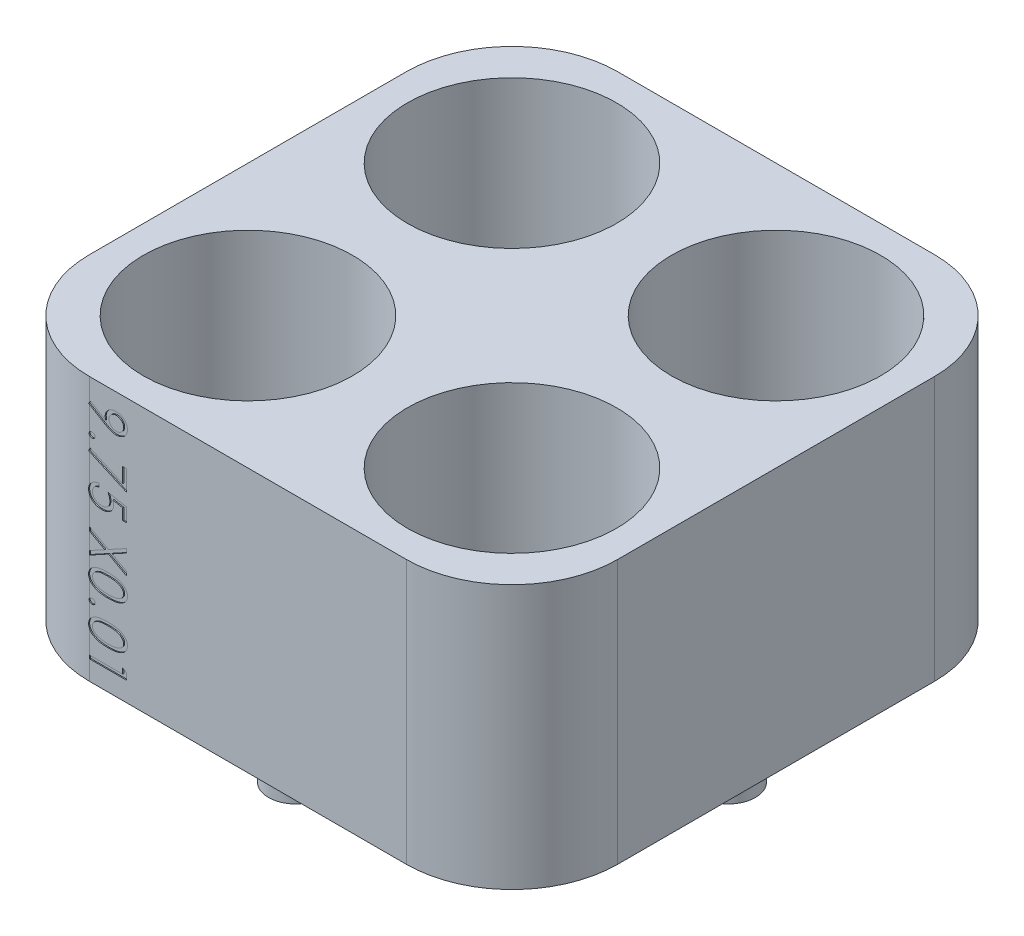
from build123d import *

# Parameters (mm, degrees)
CROQUIS1_W              = 50
CROQUIS1_H              = 50
SALIENTE_EXTRUIR1_DEPTH = 25
CROQUIS2_R              = 9.9
CORTAR_EXTRUIR1_DEPTH   = 34
MATRIZL1_COUNT          = 2
MATRIZL1_PITCH          = 25
MATRIZL1_COUNT_DIR2     = 2
MATRIZL1_PITCH_DIR2     = 25
CROQUIS3_R              = 2.55
SALIENTE_EXTRUIR2_DEPTH = 3
REDONDEO3_R             = 10
CORTAR_EXTRUIR3_DEPTH   = 0.3
CORTAR_EXTRUIR4_DEPTH   = 0.1


with BuildPart() as part:
    # Croquis1 → Saliente-Extruir1 (new body)
    with BuildSketch(Plane(origin=(0, 0, 0), x_dir=(1, 0, 0), z_dir=(0, 1, 0))):
        Rectangle(CROQUIS1_W, CROQUIS1_H)
    extrude(amount=SALIENTE_EXTRUIR1_DEPTH)

    # Croquis2 → Cortar-Extruir1 (cut)
    with BuildSketch(Plane(origin=(0, 25, 0), x_dir=(1, 0, 0), z_dir=(0, 1, 0))):
        with Locations((-12.5, 12.5)):
            Circle(CROQUIS2_R)
    cortar_extruir1 = extrude(amount=-CORTAR_EXTRUIR1_DEPTH, mode=Mode.SUBTRACT)

    # MatrizL1: Cortar-Extruir1 2 × 2
    with Locations(*[(i * MATRIZL1_PITCH, 0, j * MATRIZL1_PITCH_DIR2) for i in range(MATRIZL1_COUNT) for j in range(MATRIZL1_COUNT_DIR2) if (i, j) != (0, 0)]):
        add(cortar_extruir1, mode=Mode.SUBTRACT)

    # Croquis3 → Saliente-Extruir2 (add)
    with BuildSketch(Plane.XZ):
        Circle(CROQUIS3_R)
        with Locations((20.5, 0)):
            Circle(CROQUIS3_R)
        with Locations((-20.5, 0)):
            Circle(CROQUIS3_R)
        with Locations((0, 20.5)):
            Circle(CROQUIS3_R)
        with Locations((0, -20.5)):
            Circle(CROQUIS3_R)
    extrude(amount=SALIENTE_EXTRUIR2_DEPTH)

    # Redondeo3
    redondeo3_edges = [part.edges().sort_by_distance(p)[0] for p in [
        (-25, 12.5, -25),
        (25, 12.5, -25),
        (25, 12.5, 25),
        (-25, 12.5, 25),
    ]]
    fillet(redondeo3_edges, radius=REDONDEO3_R)

    # Croquis7 → Cortar-Extruir3 (cut)
    # profile 1 of 12: a face of its own
    with BuildSketch(Plane(origin=(0, 0, -25), x_dir=(-1, 0, 0), z_dir=(0, 0, -1))):
        with BuildLine():
            Line((7.86323481, 14.16830029), (8.484393234, 13.694695959))
            Line((8.484393234, 13.694695959), (9.149417792, 13.705076045))
            ThreePointArc((9.149417792, 13.705076045), (9.386308474, 13.714934795), (9.622367143, 13.737086445))
            ThreePointArc((9.622367143, 13.737086445), (9.785346207, 13.768816969), (9.94200435, 13.823837219))
            ThreePointArc((9.94200435, 13.823837219), (10.099622629, 13.904814199), (10.245594385, 14.005278319))
            ThreePointArc((10.245594385, 14.005278319), (10.465200323, 14.184267421), (10.678611888, 14.370598767))
            ThreePointArc((10.678611888, 14.370598767), (10.748834751, 14.437211884), (10.815736867, 14.50715947))
            ThreePointArc((10.815736867, 14.50715947), (10.875696904, 14.576852039), (10.931609178, 14.649832021))
            ThreePointArc((10.931609178, 14.649832021), (10.974783152, 14.713459238), (11.014169714, 14.779497965))
            ThreePointArc((11.014169714, 14.779497965), (11.031078423, 14.821656345), (11.036838147, 14.866712522))
            ThreePointArc((11.036838147, 14.866712522), (11.030990649, 14.911971737), (11.013832117, 14.95425855))
            ThreePointArc((11.013832117, 14.95425855), (10.973499954, 15.021137871), (10.929396147, 15.085592359))
            ThreePointArc((10.929396147, 15.085592359), (10.872271528, 15.159686265), (10.811089977, 15.230467243))
            ThreePointArc((10.811089977, 15.230467243), (10.742742286, 15.301718194), (10.671078147, 15.369632522))
            ThreePointArc((10.671078147, 15.369632522), (10.600249677, 15.435135159), (10.530965092, 15.502268711))
            ThreePointArc((10.530965092, 15.502268711), (10.470838971, 15.563883645), (10.412760147, 15.627432058))
            ThreePointArc((10.412760147, 15.627432058), (10.366750447, 15.680797919), (10.322099307, 15.735305563))
            ThreePointArc((10.322099307, 15.735305563), (10.309634741, 15.757837364), (10.305318147, 15.783222683))
            ThreePointArc((10.305318147, 15.783222683), (10.322977964, 15.817062163), (10.360836949, 15.821928047))
            ThreePointArc((10.360836949, 15.821928047), (10.464938475, 15.779174087), (10.565641792, 15.728935944))
            ThreePointArc((10.565641792, 15.728935944), (10.685479762, 15.658115338), (10.80015293, 15.579205504))
            ThreePointArc((10.80015293, 15.579205504), (10.895496521, 15.501041968), (10.982646048, 15.413835899))
            ThreePointArc((10.982646048, 15.413835899), (11.021361844, 15.375061817), (11.063691332, 15.340268761))
            ThreePointArc((11.063691332, 15.340268761), (11.112168535, 15.30717901), (11.16313288, 15.278065329))
            ThreePointArc((11.16313288, 15.278065329), (11.213198252, 15.254642568), (11.265031604, 15.235446974))
            ThreePointArc((11.265031604, 15.235446974), (11.308353468, 15.225078864), (11.352762249, 15.221594363))
            ThreePointArc((11.352762249, 15.221594363), (11.432778957, 15.21483446), (11.510527522, 15.19474639))
            ThreePointArc((11.510527522, 15.19474639), (11.581564368, 15.162282712), (11.645504209, 15.117429389))
            ThreePointArc((11.645504209, 15.117429389), (11.696555779, 15.064635334), (11.736235092, 15.002837056))
            ThreePointArc((11.736235092, 15.002837056), (11.760214617, 14.93793224), (11.768358147, 14.869220264))
            ThreePointArc((11.768358147, 14.869220264), (11.773882637, 14.831586132), (11.789989925, 14.797127414))
            ThreePointArc((11.789989925, 14.797127414), (11.834952775, 14.731856636), (11.882515317, 14.66845524))
            ThreePointArc((11.882515317, 14.66845524), (11.943740496, 14.593601157), (12.008164119, 14.521481442))
            ThreePointArc((12.008164119, 14.521481442), (12.081315107, 14.445694791), (12.156978147, 14.372415954))
            ThreePointArc((12.156978147, 14.372415954), (12.301025104, 14.230771784), (12.437977382, 14.082256901))
            ThreePointArc((12.437977382, 14.082256901), (12.458012124, 14.021175674), (12.427752835, 13.964459869))
            ThreePointArc((12.427752835, 13.964459869), (12.358977523, 13.938486362), (12.288144895, 13.95816898))
            ThreePointArc((12.288144895, 13.95816898), (12.116211023, 14.078225462), (11.949841766, 14.205881586))
            ThreePointArc((11.949841766, 14.205881586), (11.876853656, 14.261917644), (11.801451837, 14.314661079))
            ThreePointArc((11.801451837, 14.314661079), (11.725861585, 14.362479851), (11.648050447, 14.406592752))
            ThreePointArc((11.648050447, 14.406592752), (11.579899092, 14.440955957), (11.510142011, 14.471929924))
            ThreePointArc((11.510142011, 14.471929924), (11.465499719, 14.485494116), (11.419067588, 14.490074363))
            ThreePointArc((11.419067588, 14.490074363), (11.341606752, 14.476249366), (11.273710998, 14.436481562))
            ThreePointArc((11.273710998, 14.436481562), (11.144255452, 14.32108643), (11.019896144, 14.200216512))
            ThreePointArc((11.019896144, 14.200216512), (10.857872854, 14.028942281), (10.702974065, 13.851198719))
            ThreePointArc((10.702974065, 13.851198719), (10.507805241, 13.613314859), (10.317113267, 13.371827445))
            ThreePointArc((10.317113267, 13.371827445), (10.286178583, 13.322369213), (10.265700029, 13.267745957))
            ThreePointArc((10.265700029, 13.267745957), (10.244209839, 13.176834262), (10.227554828, 13.08491378))
            ThreePointArc((10.227554828, 13.08491378), (10.212396775, 12.968368546), (10.202724204, 12.851240414))
            ThreePointArc((10.202724204, 12.851240414), (10.196652192, 12.713930061), (10.194627649, 12.57650043))
            ThreePointArc((10.194627649, 12.57650043), (10.196974742, 12.407001146), (10.204014148, 12.237631837))
            ThreePointArc((10.204014148, 12.237631837), (10.215200557, 12.121142887), (10.235741268, 12.005934856))
            ThreePointArc((10.235741268, 12.005934856), (10.261858382, 11.911545635), (10.297843292, 11.820460428))
            ThreePointArc((10.297843292, 11.820460428), (10.345738461, 11.726684687), (10.401476176, 11.637347439))
            ThreePointArc((10.401476176, 11.637347439), (10.528164442, 11.461684596), (10.663203883, 11.292357395))
            ThreePointArc((10.663203883, 11.292357395), (10.809213276, 11.125907158), (10.962611178, 10.966240293))
            ThreePointArc((10.962611178, 10.966240293), (11.101492051, 10.833024694), (11.245125574, 10.70494775))
            ThreePointArc((11.245125574, 10.70494775), (11.314817945, 10.663878045), (11.394440327, 10.649594363))
            ThreePointArc((11.394440327, 10.649594363), (11.432403439, 10.654535966), (11.467836472, 10.669031398))
            ThreePointArc((11.467836472, 10.669031398), (11.530298415, 10.706475169), (11.591031755, 10.746662129))
            ThreePointArc((11.591031755, 10.746662129), (11.662143752, 10.798487213), (11.73080127, 10.853522662))
            ThreePointArc((11.73080127, 10.853522662), (11.801810134, 10.915474034), (11.870452278, 10.980037857))
            ThreePointArc((11.870452278, 10.980037857), (12.025461708, 11.125047444), (12.186538047, 11.26328679))
            ThreePointArc((12.186538047, 11.26328679), (12.254587835, 11.290007357), (12.325365272, 11.271695704))
            ThreePointArc((12.325365272, 11.271695704), (12.360505088, 11.219508638), (12.346156534, 11.158251674))
            ThreePointArc((12.346156534, 11.158251674), (12.220040997, 10.997339293), (12.086560751, 10.842481465))
            ThreePointArc((12.086560751, 10.842481465), (12.016855518, 10.762226569), (11.95034048, 10.679308431))
            ThreePointArc((11.95034048, 10.679308431), (11.889873706, 10.597140001), (11.833098581, 10.512378767))
            ThreePointArc((11.833098581, 10.512378767), (11.788334119, 10.438715394), (11.746856214, 10.363152619))
            ThreePointArc((11.746856214, 10.363152619), (11.728453997, 10.316861901), (11.719773423, 10.267809686))
            ThreePointArc((11.719773423, 10.267809686), (11.707668727, 10.198947202), (11.682064116, 10.13388593))
            ThreePointArc((11.682064116, 10.13388593), (11.64351294, 10.073656054), (11.594387786, 10.021689233))
            ThreePointArc((11.594387786, 10.021689233), (11.534949434, 9.978466356), (11.468682749, 9.946688042))
            ThreePointArc((11.468682749, 9.946688042), (11.396639148, 9.9267455), (11.322240766, 9.919474583))
            ThreePointArc((11.322240766, 9.919474583), (11.286133433, 9.914410259), (11.25249198, 9.900351828))
            ThreePointArc((11.25249198, 9.900351828), (11.187547122, 9.861253617), (11.124037342, 9.81986506))
            ThreePointArc((11.124037342, 9.81986506), (11.048996038, 9.766873755), (10.976073524, 9.711002631))
            ThreePointArc((10.976073524, 9.711002631), (10.899323235, 9.647838235), (10.824550677, 9.58234463))
            ThreePointArc((10.824550677, 9.58234463), (10.676176264, 9.455041131), (10.521481575, 9.335497413))
            ThreePointArc((10.521481575, 9.335497413), (10.461956669, 9.323518187), (10.414321119, 9.361168827))
            ThreePointArc((10.414321119, 9.361168827), (10.400671165, 9.436104359), (10.430044501, 9.506381399))
            ThreePointArc((10.430044501, 9.506381399), (10.564752999, 9.664275108), (10.706394652, 9.815980231))
            ThreePointArc((10.706394652, 9.815980231), (10.77061409, 9.883583462), (10.832948709, 9.952928456))
            ThreePointArc((10.832948709, 9.952928456), (10.887563949, 10.017750865), (10.93977038, 10.084528538))
            ThreePointArc((10.93977038, 10.084528538), (10.980684045, 10.140703557), (11.019807538, 10.198139721))
            ThreePointArc((11.019807538, 10.198139721), (11.032489007, 10.225311783), (11.036838147, 10.254980379))
            ThreePointArc((11.036838147, 10.254980379), (11.023135197, 10.323235085), (10.984149962, 10.380912005))
            ThreePointArc((10.984149962, 10.380912005), (10.738578212, 10.620957498), (10.490968322, 10.858900066))
            ThreePointArc((10.490968322, 10.858900066), (10.244458632, 11.091386657), (9.995592304, 11.321348813))
            ThreePointArc((9.995592304, 11.321348813), (9.924711735, 11.368661592), (9.842906067, 11.392544363))
            ThreePointArc((9.842906067, 11.392544363), (9.655466629, 11.412001774), (9.467225741, 11.420805266))
            ThreePointArc((9.467225741, 11.420805266), (9.206204699, 11.422735051), (8.945204291, 11.41892782))
            ThreePointArc((8.945204291, 11.41892782), (8.688312627, 11.410504285), (8.431568986, 11.398380521))
            ThreePointArc((8.431568986, 11.398380521), (8.340230633, 11.384113727), (8.253583038, 11.351889041))
            ThreePointArc((8.253583038, 11.351889041), (8.114518516, 11.272052208), (7.986888859, 11.17497733))
            ThreePointArc((7.986888859, 11.17497733), (7.796701335, 11.004093224), (7.612500855, 10.82677189))
            ThreePointArc((7.612500855, 10.82677189), (7.432971636, 10.643710566), (7.257728194, 10.456542394))
            ThreePointArc((7.257728194, 10.456542394), (7.212239352, 10.383288345), (7.196358147, 10.298534714))
            ThreePointArc((7.196358147, 10.298534714), (7.2009525, 10.260367585), (7.214472959, 10.224380989))
            ThreePointArc((7.214472959, 10.224380989), (7.24686407, 10.165753035), (7.282208785, 10.108856882))
            ThreePointArc((7.282208785, 10.108856882), (7.327836556, 10.043125429), (7.376737811, 9.979791516))
            ThreePointArc((7.376737811, 9.979791516), (7.431308227, 9.915603867), (7.488615657, 9.853847547))
            ThreePointArc((7.488615657, 9.853847547), (7.586446274, 9.759532651), (7.69044422, 9.672065193))
            ThreePointArc((7.69044422, 9.672065193), (7.768490778, 9.622876793), (7.854948437, 9.590692371))
            ThreePointArc((7.854948437, 9.590692371), (7.969762343, 9.567931888), (8.086432638, 9.558534294))
            ThreePointArc((8.086432638, 9.558534294), (8.37043584, 9.553668587), (8.654475657, 9.55197256))
            ThreePointArc((8.654475657, 9.55197256), (8.888026412, 9.54994276), (9.121511309, 9.544037031))
            ThreePointArc((9.121511309, 9.544037031), (9.26939093, 9.534580141), (9.416427255, 9.516191722))
            ThreePointArc((9.416427255, 9.516191722), (9.526066286, 9.493849289), (9.633167121, 9.461456195))
            ThreePointArc((9.633167121, 9.461456195), (9.732750872, 9.420298713), (9.82753738, 9.369050498))
            ThreePointArc((9.82753738, 9.369050498), (9.956450273, 9.276466249), (10.070011206, 9.165586622))
            ThreePointArc((10.070011206, 9.165586622), (10.154255352, 9.048207591), (10.213627052, 8.916488517))
            ThreePointArc((10.213627052, 8.916488517), (10.261377509, 8.736485332), (10.285519832, 8.551827809))
            ThreePointArc((10.285519832, 8.551827809), (10.300367247, 8.249157557), (10.305318147, 7.946163802))
            Line((10.305318147, 7.946163802), (10.305318147, 7.174874363))
            Line((10.305318147, 7.174874363), (10.030998147, 7.174874363))
            Line((10.030998147, 7.174874363), (9.756678147, 7.174874363))
            Line((9.756678147, 7.174874363), (9.756678147, 7.906394363))
            ThreePointArc((9.756678147, 7.906394363), (9.748192211, 8.215879743), (9.722760216, 8.524435128))
            ThreePointArc((9.722760216, 8.524435128), (9.679886207, 8.684546051), (9.591053515, 8.824483327))
            ThreePointArc((9.591053515, 8.824483327), (9.471610607, 8.919321671), (9.326219135, 8.965389441))
            ThreePointArc((9.326219135, 8.965389441), (9.07111708, 8.986254313), (8.815165929, 8.985067269))
            Line((8.815165929, 8.985067269), (8.247918147, 8.957954363))
            Line((8.247918147, 8.957954363), (8.221746921, 8.066414363))
            Line((8.221746921, 8.066414363), (8.195575696, 7.174874363))
            Line((8.195575696, 7.174874363), (7.924566921, 7.174874363))
            Line((7.924566921, 7.174874363), (7.653558147, 7.174874363))
            Line((7.653558147, 7.174874363), (7.653558147, 8.273443301))
            Line((7.653558147, 8.273443301), (7.653558147, 9.372012331))
            Line((7.653558147, 9.372012331), (7.356378147, 9.64236292))
            ThreePointArc((7.356378147, 9.64236292), (7.294048625, 9.695971686), (7.228832423, 9.746028814))
            ThreePointArc((7.228832423, 9.746028814), (7.16138397, 9.792011324), (7.091430747, 9.834085443))
            ThreePointArc((7.091430747, 9.834085443), (7.028567762, 9.867085285), (6.963859511, 9.896301493))
            ThreePointArc((6.963859511, 9.896301493), (6.918712844, 9.910238183), (6.871746147, 9.915393982))
            ThreePointArc((6.871746147, 9.915393982), (6.7910859, 9.923606521), (6.713072875, 9.945685677))
            ThreePointArc((6.713072875, 9.945685677), (6.643315449, 9.980347303), (6.581661068, 10.027952599))
            ThreePointArc((6.581661068, 10.027952599), (6.532164542, 10.085180748), (6.495290959, 10.151251209))
            ThreePointArc((6.495290959, 10.151251209), (6.472530746, 10.223480672), (6.464838147, 10.29881955))
            ThreePointArc((6.464838147, 10.29881955), (6.458907254, 10.342572282), (6.441542618, 10.383167189))
            ThreePointArc((6.441542618, 10.383167189), (6.397877347, 10.452240623), (6.350841819, 10.519064677))
            ThreePointArc((6.350841819, 10.519064677), (6.290002719, 10.596945165), (6.225339962, 10.671681329))
            ThreePointArc((6.225339962, 10.671681329), (6.152591882, 10.748410423), (6.076765507, 10.82209894))
            ThreePointArc((6.076765507, 10.82209894), (6.00352049, 10.892622988), (5.932545424, 10.965431049))
            ThreePointArc((5.932545424, 10.965431049), (5.875194126, 11.029425594), (5.821261024, 11.09632622))
            ThreePointArc((5.821261024, 11.09632622), (5.782785677, 11.14930283), (5.746922864, 11.204081768))
            ThreePointArc((5.746922864, 11.204081768), (5.741889711, 11.226566603), (5.751915854, 11.247312131))
            ThreePointArc((5.751915854, 11.247312131), (5.802055991, 11.273029006), (5.857781794, 11.264660859))
            ThreePointArc((5.857781794, 11.264660859), (5.996167998, 11.191907007), (6.130985952, 11.112736408))
            ThreePointArc((6.130985952, 11.112736408), (6.263942541, 11.02509534), (6.391723363, 10.930066537))
            ThreePointArc((6.391723363, 10.930066537), (6.454965216, 10.864698545), (6.498615351, 10.784903983))
            ThreePointArc((6.498615351, 10.784903983), (6.539576747, 10.720537596), (6.602398928, 10.677245087))
            ThreePointArc((6.602398928, 10.677245087), (6.680774626, 10.658791835), (6.76078517, 10.667824298))
            ThreePointArc((6.76078517, 10.667824298), (6.870383567, 10.711443901), (6.969830451, 10.774885176))
            ThreePointArc((6.969830451, 10.774885176), (7.093611904, 10.87917138), (7.209177303, 10.992494363))
            ThreePointArc((7.209177303, 10.992494363), (7.40987093, 11.212651518), (7.602386037, 11.439994956))
            ThreePointArc((7.602386037, 11.439994956), (7.716329513, 11.598522582), (7.810081024, 11.769767373))
            ThreePointArc((7.810081024, 11.769767373), (7.875045709, 11.93778874), (7.915646584, 12.113297028))
            ThreePointArc((7.915646584, 12.113297028), (7.945843333, 12.351677244), (7.961438547, 12.591455808))
            ThreePointArc((7.961438547, 12.591455808), (7.965776624, 12.780547184), (7.9657707, 12.969688315))
            ThreePointArc((7.9657707, 12.969688315), (7.959012671, 13.083491143), (7.941423062, 13.196129326))
            ThreePointArc((7.941423062, 13.196129326), (7.916094906, 13.288096933), (7.878876639, 13.375928346))
            ThreePointArc((7.878876639, 13.375928346), (7.822667555, 13.477991059), (7.759151961, 13.575674363))
            ThreePointArc((7.759151961, 13.575674363), (7.622589312, 13.762081769), (7.478977333, 13.943114024))
            ThreePointArc((7.478977333, 13.943114024), (7.347552962, 14.093088855), (7.207443144, 14.234983372))
            ThreePointArc((7.207443144, 14.234983372), (7.090713724, 14.339284353), (6.967408114, 14.435721787))
            ThreePointArc((6.967408114, 14.435721787), (6.888468536, 14.47614238), (6.800883256, 14.490074363))
            ThreePointArc((6.800883256, 14.490074363), (6.753885332, 14.484769401), (6.709252512, 14.469121435))
            ThreePointArc((6.709252512, 14.469121435), (6.637114047, 14.43206349), (6.566913625, 14.391453762))
            ThreePointArc((6.566913625, 14.391453762), (6.486007966, 14.33912434), (6.407787725, 14.282859893))
            ThreePointArc((6.407787725, 14.282859893), (6.328780658, 14.22027952), (6.252550677, 14.15434463))
            ThreePointArc((6.252550677, 14.15434463), (6.104176264, 14.027041131), (5.949481575, 13.907497413))
            ThreePointArc((5.949481575, 13.907497413), (5.889956669, 13.895518187), (5.842321119, 13.933168827))
            ThreePointArc((5.842321119, 13.933168827), (5.828671165, 14.008104359), (5.858044501, 14.078381399))
            ThreePointArc((5.858044501, 14.078381399), (5.992752999, 14.236275108), (6.134394652, 14.387980231))
            ThreePointArc((6.134394652, 14.387980231), (6.198961083, 14.456629975), (6.260909665, 14.527650991))
            ThreePointArc((6.260909665, 14.527650991), (6.315948055, 14.596336568), (6.36777038, 14.667479941))
            ThreePointArc((6.36777038, 14.667479941), (6.407953909, 14.728248662), (6.445387304, 14.790749017))
            ThreePointArc((6.445387304, 14.790749017), (6.459893185, 14.826240513), (6.464838147, 14.864261747))
            ThreePointArc((6.464838147, 14.864261747), (6.472677106, 14.932825289), (6.495789489, 14.997850101))
            ThreePointArc((6.495789489, 14.997850101), (6.534135071, 15.060305374), (6.583615964, 15.114367247))
            ThreePointArc((6.583615964, 15.114367247), (6.64448395, 15.160001587), (6.712606897, 15.193864085))
            ThreePointArc((6.712606897, 15.193864085), (6.785347973, 15.214602013), (6.860663527, 15.221594363))
            ThreePointArc((6.860663527, 15.221594363), (6.907100873, 15.226714946), (6.951306811, 15.241830583))
            ThreePointArc((6.951306811, 15.241830583), (7.021249567, 15.276934025), (7.089284193, 15.315606113))
            ThreePointArc((7.089284193, 15.315606113), (7.167315135, 15.365417761), (7.242714295, 15.419129909))
            ThreePointArc((7.242714295, 15.419129909), (7.318379889, 15.478704618), (7.391278966, 15.541634363))
            ThreePointArc((7.391278966, 15.541634363), (7.51469326, 15.651797267), (7.639417316, 15.760475063))
            ThreePointArc((7.639417316, 15.760475063), (7.694761968, 15.802705508), (7.754691518, 15.838129934))
            ThreePointArc((7.754691518, 15.838129934), (7.783412053, 15.843097109), (7.80983232, 15.830788113))
            ThreePointArc((7.80983232, 15.830788113), (7.829491006, 15.803447729), (7.836438147, 15.770497801))
            ThreePointArc((7.836438147, 15.770497801), (7.832421069, 15.742729485), (7.82069922, 15.717238025))
            ThreePointArc((7.82069922, 15.717238025), (7.78121984, 15.657930363), (7.740253782, 15.599639693))
            ThreePointArc((7.740253782, 15.599639693), (7.688417599, 15.530163842), (7.634417012, 15.462356614))
            ThreePointArc((7.634417012, 15.462356614), (7.572553478, 15.388894837), (7.509001931, 15.316888376))
            ThreePointArc((7.509001931, 15.316888376), (7.445629332, 15.243258891), (7.385868918, 15.166668549))
            ThreePointArc((7.385868918, 15.166668549), (7.334010604, 15.092308815), (7.286637773, 15.015014121))
            ThreePointArc((7.286637773, 15.015014121), (7.251515075, 14.949140803), (7.220463925, 14.88125322))
            ThreePointArc((7.220463925, 14.88125322), (7.209973585, 14.840358156), (7.211821931, 14.798179523))
            ThreePointArc((7.211821931, 14.798179523), (7.227423244, 14.75262655), (7.254905076, 14.713088933))
            ThreePointArc((7.254905076, 14.713088933), (7.334128122, 14.629762133), (7.415655407, 14.548688409))
            ThreePointArc((7.415655407, 14.548688409), (7.517822687, 14.453154516), (7.623129749, 14.361093122))
            ThreePointArc((7.623129749, 14.361093122), (7.741971738, 14.263189092), (7.86323481, 14.16830029))
        make_face()
        with BuildLine():
            ThreePointArc((6.739158147, 14.855834363), (6.740920439, 14.838040196), (6.746138859, 14.820937384))
            ThreePointArc((6.746138859, 14.820937384), (6.754625126, 14.805122561), (6.766018647, 14.791254863))
            ThreePointArc((6.766018647, 14.791254863), (6.779886344, 14.779861342), (6.795701168, 14.771375075))
            ThreePointArc((6.795701168, 14.771375075), (6.812803979, 14.766156656), (6.830598147, 14.764394363))
            ThreePointArc((6.830598147, 14.764394363), (6.848392314, 14.766156656), (6.865495125, 14.771375075))
            ThreePointArc((6.865495125, 14.771375075), (6.881309949, 14.779861342), (6.895177647, 14.791254863))
            ThreePointArc((6.895177647, 14.791254863), (6.906571168, 14.805122561), (6.915057434, 14.820937384))
            ThreePointArc((6.915057434, 14.820937384), (6.920275854, 14.838040196), (6.922038147, 14.855834363))
            ThreePointArc((6.922038147, 14.855834363), (6.920275854, 14.87362853), (6.915057434, 14.890731341))
            ThreePointArc((6.915057434, 14.890731341), (6.906571168, 14.906546165), (6.895177647, 14.920413863))
            ThreePointArc((6.895177647, 14.920413863), (6.881309949, 14.931807384), (6.865495125, 14.94029365))
            ThreePointArc((6.865495125, 14.94029365), (6.848392314, 14.94551207), (6.830598147, 14.947274363))
            ThreePointArc((6.830598147, 14.947274363), (6.812803979, 14.94551207), (6.795701168, 14.94029365))
            ThreePointArc((6.795701168, 14.94029365), (6.779886344, 14.931807384), (6.766018647, 14.920413863))
            ThreePointArc((6.766018647, 14.920413863), (6.754627038, 14.90654902), (6.746141503, 14.890737686))
            ThreePointArc((6.746141503, 14.890737686), (6.740921114, 14.8736319), (6.739158147, 14.855834363))
        make_face(mode=Mode.SUBTRACT)
        with BuildLine():
            ThreePointArc((11.311158147, 14.855834363), (11.312920439, 14.838040196), (11.318138859, 14.820937384))
            ThreePointArc((11.318138859, 14.820937384), (11.326625126, 14.805122561), (11.338018647, 14.791254863))
            ThreePointArc((11.338018647, 14.791254863), (11.351886344, 14.779861342), (11.367701168, 14.771375075))
            ThreePointArc((11.367701168, 14.771375075), (11.384803979, 14.766156656), (11.402598147, 14.764394363))
            ThreePointArc((11.402598147, 14.764394363), (11.420392314, 14.766156656), (11.437495125, 14.771375075))
            ThreePointArc((11.437495125, 14.771375075), (11.453309949, 14.779861342), (11.467177647, 14.791254863))
            ThreePointArc((11.467177647, 14.791254863), (11.478571168, 14.805122561), (11.487057434, 14.820937384))
            ThreePointArc((11.487057434, 14.820937384), (11.492275854, 14.838040196), (11.494038147, 14.855834363))
            ThreePointArc((11.494038147, 14.855834363), (11.492275854, 14.87362853), (11.487057434, 14.890731341))
            ThreePointArc((11.487057434, 14.890731341), (11.478571168, 14.906546165), (11.467177647, 14.920413863))
            ThreePointArc((11.467177647, 14.920413863), (11.453309949, 14.931807384), (11.437495125, 14.94029365))
            ThreePointArc((11.437495125, 14.94029365), (11.420392314, 14.94551207), (11.402598147, 14.947274363))
            ThreePointArc((11.402598147, 14.947274363), (11.384803979, 14.94551207), (11.367701168, 14.94029365))
            ThreePointArc((11.367701168, 14.94029365), (11.351886344, 14.931807384), (11.338018647, 14.920413863))
            ThreePointArc((11.338018647, 14.920413863), (11.326627038, 14.90654902), (11.318141503, 14.890737686))
            ThreePointArc((11.318141503, 14.890737686), (11.312921114, 14.8736319), (11.311158147, 14.855834363))
        make_face(mode=Mode.SUBTRACT)
    # profile 2 of 12: a face of its own
    with BuildSketch(Plane(origin=(0, 0, -25), x_dir=(-1, 0, 0), z_dir=(0, 0, -1))):
        with BuildLine():
            Line((-2.705799325, 14.087153792), (-2.346749747, 13.679251925))
            Line((-2.346749747, 13.679251925), (-1.664489636, 14.336123083))
            ThreePointArc((-1.664489636, 14.336123083), (-1.340372545, 14.632751979), (-1.001669176, 14.91261019))
            ThreePointArc((-1.001669176, 14.91261019), (-0.721242038, 15.109767589), (-0.421703569, 15.276462295))
            ThreePointArc((-0.421703569, 15.276462295), (-0.140136343, 15.393298546), (0.153722864, 15.474400817))
            ThreePointArc((0.153722864, 15.474400817), (0.472909584, 15.524313704), (0.795558147, 15.540725998))
            ThreePointArc((0.795558147, 15.540725998), (0.990219794, 15.5377115), (1.184718008, 15.529185721))
            ThreePointArc((1.184718008, 15.529185721), (1.316942814, 15.5158517), (1.447556436, 15.49133075))
            ThreePointArc((1.447556436, 15.49133075), (1.567567804, 15.457381196), (1.683811336, 15.412184492))
            ThreePointArc((1.683811336, 15.412184492), (1.832058458, 15.342432757), (1.977187523, 15.266405998))
            ThreePointArc((1.977187523, 15.266405998), (2.184901896, 15.137986903), (2.378818978, 14.989552104))
            ThreePointArc((2.378818978, 14.989552104), (2.577922268, 14.807696482), (2.763019134, 14.611602786))
            ThreePointArc((2.763019134, 14.611602786), (2.929305395, 14.406787508), (3.079746537, 14.190066764))
            ThreePointArc((3.079746537, 14.190066764), (3.190494769, 13.992217716), (3.277211949, 13.782719394))
            ThreePointArc((3.277211949, 13.782719394), (3.30365962, 13.695663266), (3.323316088, 13.606827056))
            ThreePointArc((3.323316088, 13.606827056), (3.344541183, 13.479486359), (3.362191073, 13.3516011))
            ThreePointArc((3.362191073, 13.3516011), (3.37769774, 13.210355874), (3.389302576, 13.068736672))
            ThreePointArc((3.389302576, 13.068736672), (3.396329664, 12.93366333), (3.399034078, 12.798434363))
            ThreePointArc((3.399034078, 12.798434363), (3.375351391, 12.417246641), (3.301663645, 12.042499974))
            ThreePointArc((3.301663645, 12.042499974), (3.181276739, 11.697005105), (3.010560016, 11.373407342))
            ThreePointArc((3.010560016, 11.373407342), (2.789877881, 11.073191381), (2.527681104, 10.808459293))
            ThreePointArc((2.527681104, 10.808459293), (2.210910601, 10.56383075), (1.867435749, 10.358375885))
            ThreePointArc((1.867435749, 10.358375885), (1.757665909, 10.306007761), (1.644531547, 10.261370847))
            ThreePointArc((1.644531547, 10.261370847), (1.532011469, 10.226185529), (1.417141572, 10.199658539))
            ThreePointArc((1.417141572, 10.199658539), (1.2835302, 10.178443387), (1.14885012, 10.165662245))
            ThreePointArc((1.14885012, 10.165662245), (0.97229159, 10.157029382), (0.795558147, 10.153461314))
            ThreePointArc((0.795558147, 10.153461314), (0.47078588, 10.168435363), (0.149315731, 10.216996569))
            ThreePointArc((0.149315731, 10.216996569), (-0.144993135, 10.296781441), (-0.426970879, 10.412849893))
            ThreePointArc((-0.426970879, 10.412849893), (-0.724075437, 10.577964032), (-1.001698437, 10.774074378))
            ThreePointArc((-1.001698437, 10.774074378), (-1.333202357, 11.05076727), (-1.649501356, 11.344720921))
            Line((-1.649501356, 11.344720921), (-2.311972829, 11.994123825))
            Line((-2.311972829, 11.994123825), (-2.98104074, 11.344721301))
            ThreePointArc((-2.98104074, 11.344721301), (-3.2994389, 11.051332512), (-3.632624107, 10.774851069))
            ThreePointArc((-3.632624107, 10.774851069), (-3.910329122, 10.579202856), (-4.207162932, 10.414012096))
            ThreePointArc((-4.207162932, 10.414012096), (-4.487778328, 10.297754944), (-4.780633739, 10.217154486))
            ThreePointArc((-4.780633739, 10.217154486), (-5.099780281, 10.167353367), (-5.422361853, 10.150746277))
            ThreePointArc((-5.422361853, 10.150746277), (-5.683210183, 10.15996733), (-5.942769662, 10.18745834))
            ThreePointArc((-5.942769662, 10.18745834), (-6.159754494, 10.230965026), (-6.370345388, 10.298985056))
            ThreePointArc((-6.370345388, 10.298985056), (-6.575177721, 10.391840457), (-6.768365054, 10.506979784))
            ThreePointArc((-6.768365054, 10.506979784), (-6.989082303, 10.666285334), (-7.199234083, 10.839289935))
            ThreePointArc((-7.199234083, 10.839289935), (-7.435919474, 11.085308822), (-7.628023584, 11.367516686))
            ThreePointArc((-7.628023584, 11.367516686), (-7.799462402, 11.716750863), (-7.929966785, 12.083253776))
            ThreePointArc((-7.929966785, 12.083253776), (-8.018510626, 12.464652856), (-8.063221382, 12.853633856))
            ThreePointArc((-8.063221382, 12.853633856), (-8.055261199, 13.201874698), (-7.99160722, 13.544341075))
            ThreePointArc((-7.99160722, 13.544341075), (-7.88146403, 13.858258165), (-7.726695665, 14.152744522))
            ThreePointArc((-7.726695665, 14.152744522), (-7.513519924, 14.458121778), (-7.269606399, 14.739556241))
            ThreePointArc((-7.269606399, 14.739556241), (-6.999851735, 14.991709672), (-6.705075955, 15.214097106))
            ThreePointArc((-6.705075955, 15.214097106), (-6.42348408, 15.373745015), (-6.120532771, 15.487771082))
            ThreePointArc((-6.120532771, 15.487771082), (-5.945253309, 15.530488712), (-5.76695011, 15.557977891))
            ThreePointArc((-5.76695011, 15.557977891), (-5.574972509, 15.572302493), (-5.382462466, 15.572993162))
            ThreePointArc((-5.382462466, 15.572993162), (-5.187162087, 15.559932697), (-4.993248972, 15.533277165))
            ThreePointArc((-4.993248972, 15.533277165), (-4.807569909, 15.49374198), (-4.625457407, 15.44012499))
            ThreePointArc((-4.625457407, 15.44012499), (-4.394487843, 15.349595629), (-4.173474242, 15.236921353))
            ThreePointArc((-4.173474242, 15.236921353), (-3.900498529, 15.071879199), (-3.635536014, 14.894257359))
            ThreePointArc((-3.635536014, 14.894257359), (-3.369865663, 14.697628998), (-3.113605638, 14.488884545))
            ThreePointArc((-3.113605638, 14.488884545), (-2.902557137, 14.295272576), (-2.705799325, 14.087153792))
        make_face()
        with BuildLine():
            Line((0.882744496, 14.633629533), (0.762928697, 14.666152598))
            ThreePointArc((0.762928697, 14.666152598), (0.75910369, 14.665971744), (0.756101695, 14.663594473))
            ThreePointArc((0.756101695, 14.663594473), (0.753191606, 14.660589878), (0.749410756, 14.658800639))
            ThreePointArc((0.749410756, 14.658800639), (0.708006752, 14.647722095), (0.66658349, 14.636715776))
            ThreePointArc((0.66658349, 14.636715776), (0.619163818, 14.624355438), (0.571650468, 14.612360236))
            ThreePointArc((0.571650468, 14.612360236), (0.515935139, 14.598664265), (0.460154581, 14.585236428))
            ThreePointArc((0.460154581, 14.585236428), (0.390108823, 14.566173664), (0.321420258, 14.54268583))
            ThreePointArc((0.321420258, 14.54268583), (0.229825407, 14.50668615), (0.139206399, 14.468296189))
            ThreePointArc((0.139206399, 14.468296189), (0.042637264, 14.42438658), (-0.05276548, 14.377997269))
            ThreePointArc((-0.05276548, 14.377997269), (-0.139965622, 14.332413676), (-0.225645419, 14.284032885))
            ThreePointArc((-0.225645419, 14.284032885), (-0.427006806, 14.152495655), (-0.614702045, 14.002099682))
            ThreePointArc((-0.614702045, 14.002099682), (-0.871131018, 13.767627669), (-1.119564505, 13.52470022))
            ThreePointArc((-1.119564505, 13.52470022), (-1.359697765, 13.276750347), (-1.594587347, 13.023827423))
            ThreePointArc((-1.594587347, 13.023827423), (-1.652953902, 12.929369847), (-1.673323405, 12.820218706))
            ThreePointArc((-1.673323405, 12.820218706), (-1.647435931, 12.691732851), (-1.573812911, 12.583296569))
            ThreePointArc((-1.573812911, 12.583296569), (-1.283091097, 12.30480791), (-0.985983098, 12.03314278))
            ThreePointArc((-0.985983098, 12.03314278), (-0.679675018, 11.769294558), (-0.364057779, 11.516655919))
            ThreePointArc((-0.364057779, 11.516655919), (-0.14056717, 11.36373108), (0.098847071, 11.237181171))
            ThreePointArc((0.098847071, 11.237181171), (0.363608868, 11.137493159), (0.639595708, 11.075301739))
            ThreePointArc((0.639595708, 11.075301739), (0.89300828, 11.06086948), (1.144551162, 11.094816498))
            ThreePointArc((1.144551162, 11.094816498), (1.389970918, 11.176848012), (1.616009584, 11.302810494))
            ThreePointArc((1.616009584, 11.302810494), (1.849381242, 11.485262575), (2.058295172, 11.695277009))
            ThreePointArc((2.058295172, 11.695277009), (2.30446923, 12.058995177), (2.452567261, 12.472467723))
            ThreePointArc((2.452567261, 12.472467723), (2.492704199, 12.908521951), (2.42230437, 13.340723441))
            ThreePointArc((2.42230437, 13.340723441), (2.245340457, 13.743664604), (1.973687477, 14.089905077))
            ThreePointArc((1.973687477, 14.089905077), (1.622407288, 14.36086322), (1.215794078, 14.538294285))
            ThreePointArc((1.215794078, 14.538294285), (1.128695237, 14.563958077), (1.041487858, 14.589250596))
            ThreePointArc((1.041487858, 14.589250596), (0.96219993, 14.611739647), (0.882744496, 14.633629533))
        make_face(mode=Mode.SUBTRACT)
        with BuildLine():
            ThreePointArc((-5.867958117, 14.532370758), (-6.044785384, 14.467822949), (-6.213296456, 14.38392825))
            ThreePointArc((-6.213296456, 14.38392825), (-6.374351874, 14.280443573), (-6.523502724, 14.160435449))
            ThreePointArc((-6.523502724, 14.160435449), (-6.661796493, 14.022833579), (-6.785019296, 13.871586821))
            ThreePointArc((-6.785019296, 13.871586821), (-6.894150709, 13.705755991), (-6.986364141, 13.529954363))
            ThreePointArc((-6.986364141, 13.529954363), (-7.078276514, 13.28445653), (-7.132284367, 13.02794099))
            ThreePointArc((-7.132284367, 13.02794099), (-7.144059604, 12.776764706), (-7.11301805, 12.527235941))
            ThreePointArc((-7.11301805, 12.527235941), (-7.038525653, 12.278292918), (-6.924536527, 12.044780122))
            ThreePointArc((-6.924536527, 12.044780122), (-6.764336835, 11.809712292), (-6.57612361, 11.596412952))
            ThreePointArc((-6.57612361, 11.596412952), (-6.267676209, 11.343071001), (-5.915881181, 11.15449157))
            ThreePointArc((-5.915881181, 11.15449157), (-5.573785808, 11.065467358), (-5.22040564, 11.074243003))
            ThreePointArc((-5.22040564, 11.074243003), (-4.820165418, 11.185883343), (-4.452952189, 11.380331911))
            ThreePointArc((-4.452952189, 11.380331911), (-3.996325271, 11.718752158), (-3.570701853, 12.095423252))
            ThreePointArc((-3.570701853, 12.095423252), (-3.451365919, 12.212786724), (-3.334228138, 12.3323442))
            ThreePointArc((-3.334228138, 12.3323442), (-3.233044933, 12.440410892), (-3.134790183, 12.551146861))
            ThreePointArc((-3.134790183, 12.551146861), (-3.055808103, 12.644291358), (-2.978526629, 12.738851602))
            ThreePointArc((-2.978526629, 12.738851602), (-2.959925411, 12.772334068), (-2.953481853, 12.810090677))
            ThreePointArc((-2.953481853, 12.810090677), (-2.975671282, 12.927827106), (-3.039195058, 13.029409425))
            ThreePointArc((-3.039195058, 13.029409425), (-3.289274497, 13.294531567), (-3.545167965, 13.554046517))
            ThreePointArc((-3.545167965, 13.554046517), (-3.808754122, 13.806696356), (-4.08083839, 14.050170696))
            ThreePointArc((-4.08083839, 14.050170696), (-4.272172066, 14.197739666), (-4.478765518, 14.323056551))
            ThreePointArc((-4.478765518, 14.323056551), (-4.676302935, 14.421480132), (-4.878888762, 14.509042768))
            ThreePointArc((-4.878888762, 14.509042768), (-5.040630863, 14.563184156), (-5.20753985, 14.598300918))
            ThreePointArc((-5.20753985, 14.598300918), (-5.363814925, 14.611452546), (-5.520467622, 14.604050045))
            ThreePointArc((-5.520467622, 14.604050045), (-5.695837797, 14.576087805), (-5.867958117, 14.532370758))
        make_face(mode=Mode.SUBTRACT)
    # profile 3 of 12: a face of its own
    with BuildSketch(Plane(origin=(0, 0, -25), x_dir=(-1, 0, 0), z_dir=(0, 0, -1))):
        with BuildLine():
            Line((-9.449879789, 8.729354363), (-8.805641853, 8.729354363))
            Line((-8.805641853, 8.729354363), (-8.805641853, 8.455034363))
            Line((-8.805641853, 8.455034363), (-8.805641853, 8.180714363))
            Line((-8.805641853, 8.180714363), (-9.406361597, 8.180714363))
            ThreePointArc((-9.406361597, 8.180714363), (-9.594247509, 8.179597168), (-9.782106845, 8.176245416))
            ThreePointArc((-9.782106845, 8.176245416), (-9.850325852, 8.169109161), (-9.916520719, 8.151136997))
            ThreePointArc((-9.916520719, 8.151136997), (-9.951525387, 8.127742237), (-9.971504871, 8.09068199))
            ThreePointArc((-9.971504871, 8.09068199), (-9.980370032, 8.033140597), (-9.977861597, 7.974974363))
            ThreePointArc((-9.977861597, 7.974974363), (-9.962494187, 7.915549116), (-9.934312931, 7.861020829))
            ThreePointArc((-9.934312931, 7.861020829), (-9.89791743, 7.823063728), (-9.85069416, 7.799926382))
            ThreePointArc((-9.85069416, 7.799926382), (-9.767662294, 7.78170012), (-9.68298177, 7.774237137))
            ThreePointArc((-9.68298177, 7.774237137), (-9.472935724, 7.770485101), (-9.262859893, 7.769234363))
            Line((-9.262859893, 7.769234363), (-8.577041853, 7.769234363))
            Line((-8.577041853, 7.769234363), (-8.577041853, 8.363594363))
            Line((-8.577041853, 8.363594363), (-8.577041853, 8.957954363))
            Line((-8.577041853, 8.957954363), (-9.285701853, 8.984660695))
            Line((-9.285701853, 8.984660695), (-9.994361853, 9.011367119))
            Line((-9.994361853, 9.011367119), (-9.994361853, 9.281840695))
            Line((-9.994361853, 9.281840695), (-9.994361853, 9.552314363))
            Line((-9.994361853, 9.552314363), (-9.304023955, 9.552314363))
            ThreePointArc((-9.304023955, 9.552314363), (-9.151991991, 9.550090569), (-9.000090111, 9.543421091))
            ThreePointArc((-9.000090111, 9.543421091), (-8.864456734, 9.532698917), (-8.729373029, 9.516457904))
            ThreePointArc((-8.729373029, 9.516457904), (-8.617323193, 9.498037976), (-8.506233914, 9.474508598))
            ThreePointArc((-8.506233914, 9.474508598), (-8.428887071, 9.451172367), (-8.354981734, 9.418536271))
            ThreePointArc((-8.354981734, 9.418536271), (-8.248891935, 9.354107547), (-8.152598862, 9.275789287))
            ThreePointArc((-8.152598862, 9.275789287), (-8.08766015, 9.197958026), (-8.043834274, 9.106557622))
            ThreePointArc((-8.043834274, 9.106557622), (-8.009830389, 8.975164388), (-7.994427778, 8.840319272))
            ThreePointArc((-7.994427778, 8.840319272), (-7.985618712, 8.573343886), (-7.982681853, 8.306239354))
            ThreePointArc((-7.982681853, 8.306239354), (-7.984592975, 8.110338822), (-7.99032578, 7.914512863))
            ThreePointArc((-7.99032578, 7.914512863), (-8.000016004, 7.807034658), (-8.020577607, 7.701097481))
            ThreePointArc((-8.020577607, 7.701097481), (-8.04711551, 7.622378517), (-8.086230521, 7.54909174))
            ThreePointArc((-8.086230521, 7.54909174), (-8.142694301, 7.470989285), (-8.207125448, 7.399317958))
            ThreePointArc((-8.207125448, 7.399317958), (-8.281983553, 7.332705884), (-8.364073796, 7.275242016))
            ThreePointArc((-8.364073796, 7.275242016), (-8.442611624, 7.235667855), (-8.526751408, 7.210078763))
            ThreePointArc((-8.526751408, 7.210078763), (-8.646757042, 7.19024871), (-8.768071992, 7.181458591))
            ThreePointArc((-8.768071992, 7.181458591), (-9.015435017, 7.176520378), (-9.262841853, 7.174874363))
            ThreePointArc((-9.262841853, 7.174874363), (-9.51024869, 7.176520378), (-9.757611715, 7.181458591))
            ThreePointArc((-9.757611715, 7.181458591), (-9.878926665, 7.19024871), (-9.998932299, 7.210078763))
            ThreePointArc((-9.998932299, 7.210078763), (-10.083072082, 7.235667855), (-10.161609911, 7.275242016))
            ThreePointArc((-10.161609911, 7.275242016), (-10.243700154, 7.332705884), (-10.318558258, 7.399317958))
            ThreePointArc((-10.318558258, 7.399317958), (-10.371562499, 7.457312812), (-10.419148385, 7.5198303))
            ThreePointArc((-10.419148385, 7.5198303), (-10.457569882, 7.58240197), (-10.488890222, 7.648813278))
            ThreePointArc((-10.488890222, 7.648813278), (-10.513026959, 7.718961725), (-10.529419996, 7.791312642))
            ThreePointArc((-10.529419996, 7.791312642), (-10.539600384, 7.871427217), (-10.543001853, 7.952114363))
            ThreePointArc((-10.543001853, 7.952114363), (-10.539600384, 8.032801508), (-10.529419996, 8.112916083))
            ThreePointArc((-10.529419996, 8.112916083), (-10.513026959, 8.185267), (-10.488890222, 8.255415448))
            ThreePointArc((-10.488890222, 8.255415448), (-10.457569882, 8.321826755), (-10.419148385, 8.384398426))
            ThreePointArc((-10.419148385, 8.384398426), (-10.371562499, 8.446915913), (-10.318558258, 8.504910768))
            ThreePointArc((-10.318558258, 8.504910768), (-10.247829114, 8.568654167), (-10.170875709, 8.624725606))
            ThreePointArc((-10.170875709, 8.624725606), (-10.098901139, 8.663723853), (-10.021566168, 8.690566063))
            ThreePointArc((-10.021566168, 8.690566063), (-9.919322558, 8.711352579), (-9.815467997, 8.721355832))
            ThreePointArc((-9.815467997, 8.721355832), (-9.632717637, 8.727354491), (-9.449879789, 8.729354363))
        make_face()
    # profile 4 of 12: a face of its own
    with BuildSketch(Plane(origin=(0, 0, -25), x_dir=(-1, 0, 0), z_dir=(0, 0, -1))):
        with BuildLine():
            Line((-5.422361853, 9.281840695), (-5.422361853, 9.011367119))
            Line((-5.422361853, 9.011367119), (-6.131021854, 8.984660695))
            Line((-6.131021854, 8.984660695), (-6.839681853, 8.957954363))
            Line((-6.839681853, 8.957954363), (-6.865853079, 8.066414363))
            Line((-6.865853079, 8.066414363), (-6.892024304, 7.174874363))
            Line((-6.892024304, 7.174874363), (-7.163033079, 7.174874363))
            Line((-7.163033079, 7.174874363), (-7.434041853, 7.174874363))
            Line((-7.434041853, 7.174874363), (-7.434041853, 8.174097723))
            ThreePointArc((-7.434041853, 8.174097723), (-7.432726055, 8.492471747), (-7.42877875, 8.810824019))
            ThreePointArc((-7.42877875, 8.810824019), (-7.420851191, 8.937722318), (-7.401333948, 9.063361091))
            ThreePointArc((-7.401333948, 9.063361091), (-7.37536816, 9.144848189), (-7.332466461, 9.218833414))
            ThreePointArc((-7.332466461, 9.218833414), (-7.267659793, 9.295530993), (-7.193110346, 9.362797648))
            ThreePointArc((-7.193110346, 9.362797648), (-7.115994541, 9.416238929), (-7.032991591, 9.459980537))
            ThreePointArc((-7.032991591, 9.459980537), (-6.944887807, 9.493640199), (-6.853408003, 9.516590035))
            ThreePointArc((-6.853408003, 9.516590035), (-6.728479543, 9.535326066), (-6.602500849, 9.544681683))
            ThreePointArc((-6.602500849, 9.544681683), (-6.394919332, 9.550406032), (-6.187267669, 9.552314363))
            Line((-6.187267669, 9.552314363), (-5.422361853, 9.552314363))
            Line((-5.422361853, 9.552314363), (-5.422361853, 9.281840695))
        make_face()
    # profile 5 of 12: a face of its own
    with BuildSketch(Plane(origin=(0, 0, -25), x_dir=(-1, 0, 0), z_dir=(0, 0, -1))):
        with BuildLine():
            Line((-2.953481853, 9.277994363), (-2.953481853, 9.003674363))
            Line((-2.953481853, 9.003674363), (-3.620993853, 9.003674363))
            ThreePointArc((-3.620993853, 9.003674363), (-3.759847663, 9.001808716), (-3.898601213, 8.996212859))
            ThreePointArc((-3.898601213, 8.996212859), (-4.016596637, 8.987302673), (-4.134096429, 8.973298726))
            ThreePointArc((-4.134096429, 8.973298726), (-4.225730506, 8.958295606), (-4.316614509, 8.939269422))
            ThreePointArc((-4.316614509, 8.939269422), (-4.360600308, 8.922327572), (-4.398233853, 8.893946363))
            ThreePointArc((-4.398233853, 8.893946363), (-4.428326568, 8.853481173), (-4.445500561, 8.806067494))
            ThreePointArc((-4.445500561, 8.806067494), (-4.464300105, 8.703352755), (-4.478867291, 8.599952864))
            ThreePointArc((-4.478867291, 8.599952864), (-4.492612998, 8.462592863), (-4.500940359, 8.3247982))
            ThreePointArc((-4.500940359, 8.3247982), (-4.506206298, 8.152211329), (-4.507961853, 7.979553065))
            Line((-4.507961853, 7.979553065), (-4.507961853, 7.174874363))
            Line((-4.507961853, 7.174874363), (-4.790605179, 7.174874363))
            Line((-4.790605179, 7.174874363), (-5.073248505, 7.174874363))
            Line((-5.073248505, 7.174874363), (-5.042065529, 8.143068086))
            ThreePointArc((-5.042065529, 8.143068086), (-5.030803038, 8.447112776), (-5.016604626, 8.751034512))
            ThreePointArc((-5.016604626, 8.751034512), (-5.003945748, 8.879781979), (-4.979386717, 9.00679777))
            ThreePointArc((-4.979386717, 9.00679777), (-4.949348563, 9.092735685), (-4.903029288, 9.171107495))
            ThreePointArc((-4.903029288, 9.171107495), (-4.83326579, 9.255700646), (-4.754322793, 9.331798939))
            ThreePointArc((-4.754322793, 9.331798939), (-4.671852644, 9.395678375), (-4.583312802, 9.450838183))
            ThreePointArc((-4.583312802, 9.450838183), (-4.499685096, 9.48943988), (-4.41129176, 9.515330083))
            ThreePointArc((-4.41129176, 9.515330083), (-4.291571064, 9.535474451), (-4.170534354, 9.544906077))
            ThreePointArc((-4.170534354, 9.544906077), (-3.948109486, 9.550462163), (-3.725622944, 9.552314363))
            Line((-3.725622944, 9.552314363), (-2.953481853, 9.552314363))
            Line((-2.953481853, 9.552314363), (-2.953481853, 9.277994363))
        make_face()
    # profile 6 of 12: a face of its own
    with BuildSketch(Plane(origin=(0, 0, -25), x_dir=(-1, 0, 0), z_dir=(0, 0, -1))):
        with BuildLine():
            Line((-1.166248183, 7.997834363), (-1.856201853, 7.997834363))
            Line((-1.856201853, 7.997834363), (-1.856201853, 8.272154363))
            Line((-1.856201853, 8.272154363), (-1.856201853, 8.546474363))
            Line((-1.856201853, 8.546474363), (-1.20976211, 8.546474363))
            ThreePointArc((-1.20976211, 8.546474363), (-1.005881315, 8.547553885), (-0.802023377, 8.550791977))
            ThreePointArc((-0.802023377, 8.550791977), (-0.729526506, 8.557796602), (-0.658895546, 8.575576606))
            ThreePointArc((-0.658895546, 8.575576606), (-0.622221402, 8.598778937), (-0.600581698, 8.636396276))
            ThreePointArc((-0.600581698, 8.636396276), (-0.590447751, 8.693880901), (-0.59254211, 8.752214363))
            ThreePointArc((-0.59254211, 8.752214363), (-0.607909519, 8.81163961), (-0.636090776, 8.866167897))
            ThreePointArc((-0.636090776, 8.866167897), (-0.672486277, 8.904124998), (-0.719709547, 8.927262344))
            ThreePointArc((-0.719709547, 8.927262344), (-0.802741412, 8.945488605), (-0.887421937, 8.952951589))
            ThreePointArc((-0.887421937, 8.952951589), (-1.097467982, 8.956703625), (-1.307543813, 8.957954363))
            Line((-1.307543813, 8.957954363), (-1.993361853, 8.957954363))
            Line((-1.993361853, 8.957954363), (-1.993361853, 8.363594363))
            Line((-1.993361853, 8.363594363), (-1.993361853, 7.769234363))
            Line((-1.993361853, 7.769234363), (-1.376141853, 7.742196469))
            Line((-1.376141853, 7.742196469), (-0.758921853, 7.715158576))
            Line((-0.758921853, 7.715158576), (-0.758921853, 7.435334345))
            Line((-0.758921853, 7.435334345), (-0.758921853, 7.155510114))
            Line((-0.758921853, 7.155510114), (-1.499396958, 7.189136888))
            ThreePointArc((-1.499396958, 7.189136888), (-1.809847203, 7.212866107), (-2.11823881, 7.255726891))
            ThreePointArc((-2.11823881, 7.255726891), (-2.277978742, 7.311178208), (-2.411106499, 7.41543124))
            ThreePointArc((-2.411106499, 7.41543124), (-2.506129897, 7.559360849), (-2.551783647, 7.725676553))
            ThreePointArc((-2.551783647, 7.725676553), (-2.578730343, 8.051284016), (-2.587721853, 8.377880857))
            ThreePointArc((-2.587721853, 8.377880857), (-2.58589905, 8.588589919), (-2.580431525, 8.79923592))
            ThreePointArc((-2.580431525, 8.79923592), (-2.571047019, 8.910757758), (-2.550718646, 9.020812048))
            ThreePointArc((-2.550718646, 9.020812048), (-2.524490035, 9.101095386), (-2.485241662, 9.175881212))
            ThreePointArc((-2.485241662, 9.175881212), (-2.428412163, 9.255207908), (-2.363278258, 9.327870768))
            ThreePointArc((-2.363278258, 9.327870768), (-2.288420154, 9.394482842), (-2.206329911, 9.45194671))
            ThreePointArc((-2.206329911, 9.45194671), (-2.127792082, 9.491520871), (-2.043652299, 9.517109963))
            ThreePointArc((-2.043652299, 9.517109963), (-1.923646665, 9.536940015), (-1.802331715, 9.545730134))
            ThreePointArc((-1.802331715, 9.545730134), (-1.55496869, 9.550668348), (-1.307561853, 9.552314363))
            ThreePointArc((-1.307561853, 9.552314363), (-1.060155017, 9.550668348), (-0.812791992, 9.545730134))
            ThreePointArc((-0.812791992, 9.545730134), (-0.691477042, 9.536940015), (-0.571471408, 9.517109963))
            ThreePointArc((-0.571471408, 9.517109963), (-0.48733143, 9.491520793), (-0.408793439, 9.45194649))
            ThreePointArc((-0.408793439, 9.45194649), (-0.326703388, 9.394482711), (-0.251845448, 9.327870768))
            ThreePointArc((-0.251845448, 9.327870768), (-0.198841207, 9.269875913), (-0.151255322, 9.207358426))
            ThreePointArc((-0.151255322, 9.207358426), (-0.112833824, 9.144786755), (-0.081513485, 9.078375448))
            ThreePointArc((-0.081513485, 9.078375448), (-0.057376748, 9.008227), (-0.040983711, 8.935876083))
            ThreePointArc((-0.040983711, 8.935876083), (-0.030803323, 8.855761508), (-0.027401853, 8.775074363))
            ThreePointArc((-0.027401853, 8.775074363), (-0.030803323, 8.694387217), (-0.040983711, 8.614272642))
            ThreePointArc((-0.040983711, 8.614272642), (-0.057376748, 8.541921725), (-0.081513485, 8.471773278))
            ThreePointArc((-0.081513485, 8.471773278), (-0.112833824, 8.40536197), (-0.151255322, 8.3427903))
            ThreePointArc((-0.151255322, 8.3427903), (-0.198841207, 8.280272812), (-0.251845448, 8.222277958))
            ThreePointArc((-0.251845448, 8.222277958), (-0.323693828, 8.157719672), (-0.402013794, 8.101186983))
            ThreePointArc((-0.402013794, 8.101186983), (-0.475559446, 8.062048972), (-0.554549704, 8.03556717))
            ThreePointArc((-0.554549704, 8.03556717), (-0.661204872, 8.015047542), (-0.769387893, 8.00541355))
            ThreePointArc((-0.769387893, 8.00541355), (-0.967781855, 7.999729332), (-1.166248183, 7.997834363))
        make_face()
    # profile 7 of 12: a face of its own
    with BuildSketch(Plane(origin=(0, 0, -25), x_dir=(-1, 0, 0), z_dir=(0, 0, -1))):
        with BuildLine():
            Line((2.441478147, 9.281840695), (2.441478147, 9.011367119))
            Line((2.441478147, 9.011367119), (1.732818147, 8.984660695))
            Line((1.732818147, 8.984660695), (1.024158147, 8.957954363))
            Line((1.024158147, 8.957954363), (0.997986921, 8.066414363))
            Line((0.997986921, 8.066414363), (0.971815696, 7.174874363))
            Line((0.971815696, 7.174874363), (0.700806921, 7.174874363))
            Line((0.700806921, 7.174874363), (0.429798147, 7.174874363))
            Line((0.429798147, 7.174874363), (0.429798147, 8.174097723))
            ThreePointArc((0.429798147, 8.174097723), (0.431113945, 8.492471747), (0.43506125, 8.810824019))
            ThreePointArc((0.43506125, 8.810824019), (0.442988809, 8.937722318), (0.462506052, 9.063361091))
            ThreePointArc((0.462506052, 9.063361091), (0.48847184, 9.144848189), (0.531373539, 9.218833414))
            ThreePointArc((0.531373539, 9.218833414), (0.596180207, 9.295530993), (0.670729654, 9.362797648))
            ThreePointArc((0.670729654, 9.362797648), (0.747845459, 9.416238929), (0.830848409, 9.459980537))
            ThreePointArc((0.830848409, 9.459980537), (0.918952193, 9.493640199), (1.010431997, 9.516590035))
            ThreePointArc((1.010431997, 9.516590035), (1.135360457, 9.535326066), (1.261339151, 9.544681683))
            ThreePointArc((1.261339151, 9.544681683), (1.468920668, 9.550406032), (1.676572331, 9.552314363))
            Line((1.676572331, 9.552314363), (2.441478147, 9.552314363))
            Line((2.441478147, 9.552314363), (2.441478147, 9.281840695))
        make_face()
    # profile 8 of 12: a face of its own
    with BuildSketch(Plane(origin=(0, 0, -25), x_dir=(-1, 0, 0), z_dir=(0, 0, -1))):
        with BuildLine():
            Line((3.671764476, 8.729354363), (4.361718147, 8.729354363))
            Line((4.361718147, 8.729354363), (4.361718147, 8.455034363))
            Line((4.361718147, 8.455034363), (4.361718147, 8.180714363))
            Line((4.361718147, 8.180714363), (3.715278403, 8.180714363))
            ThreePointArc((3.715278403, 8.180714363), (3.511397608, 8.17963484), (3.307539671, 8.176396749))
            ThreePointArc((3.307539671, 8.176396749), (3.2350428, 8.169392124), (3.164411839, 8.15161212))
            ThreePointArc((3.164411839, 8.15161212), (3.127737695, 8.128409789), (3.106097991, 8.09079245))
            ThreePointArc((3.106097991, 8.09079245), (3.095964044, 8.033307824), (3.098058403, 7.974974363))
            ThreePointArc((3.098058403, 7.974974363), (3.113166152, 7.916058137), (3.140760518, 7.861855585))
            ThreePointArc((3.140760518, 7.861855585), (3.176726178, 7.822800505), (3.223325717, 7.797358198))
            ThreePointArc((3.223325717, 7.797358198), (3.303492333, 7.775139417), (3.385885371, 7.763661278))
            ThreePointArc((3.385885371, 7.763661278), (3.575454806, 7.751301824), (3.765185167, 7.741724913))
            ThreePointArc((3.765185167, 7.741724913), (3.998098847, 7.737880622), (4.230887532, 7.746424015))
            ThreePointArc((4.230887532, 7.746424015), (4.357765705, 7.771907184), (4.473257847, 7.830294063))
            ThreePointArc((4.473257847, 7.830294063), (4.551945927, 7.909133344), (4.597136005, 8.010943475))
            ThreePointArc((4.597136005, 8.010943475), (4.626279096, 8.175011964), (4.636038147, 8.341362647))
            ThreePointArc((4.636038147, 8.341362647), (4.627536589, 8.523283997), (4.602105677, 8.703619581))
            ThreePointArc((4.602105677, 8.703619581), (4.561715697, 8.807634811), (4.486677582, 8.890216891))
            ThreePointArc((4.486677582, 8.890216891), (4.376216124, 8.952046629), (4.253007782, 8.98110441))
            ThreePointArc((4.253007782, 8.98110441), (4.008836529, 8.998028871), (3.764144546, 9.003674363))
            Line((3.764144546, 9.003674363), (3.081558147, 9.003674363))
            Line((3.081558147, 9.003674363), (3.081558147, 9.277994363))
            Line((3.081558147, 9.277994363), (3.081558147, 9.552314363))
            Line((3.081558147, 9.552314363), (3.862966796, 9.552314363))
            ThreePointArc((3.862966796, 9.552314363), (4.093001797, 9.550591216), (4.322985169, 9.545422164))
            ThreePointArc((4.322985169, 9.545422164), (4.439700994, 9.536375309), (4.555036571, 9.516322024))
            ThreePointArc((4.555036571, 9.516322024), (4.637354534, 9.490450217), (4.714110974, 9.451028823))
            ThreePointArc((4.714110974, 9.451028823), (4.79493513, 9.393823566), (4.868794552, 9.327870768))
            ThreePointArc((4.868794552, 9.327870768), (4.934146964, 9.254893008), (4.991082293, 9.17517438))
            ThreePointArc((4.991082293, 9.17517438), (5.030375101, 9.099887097), (5.05650807, 9.019083832))
            ThreePointArc((5.05650807, 9.019083832), (5.076763303, 8.907672783), (5.086055718, 8.794817356))
            ThreePointArc((5.086055718, 8.794817356), (5.091442329, 8.579235763), (5.093238147, 8.363594363))
            ThreePointArc((5.093238147, 8.363594363), (5.091442329, 8.147952962), (5.086055718, 7.932371369))
            ThreePointArc((5.086055718, 7.932371369), (5.076763303, 7.819515943), (5.05650807, 7.708104894))
            ThreePointArc((5.05650807, 7.708104894), (5.030375101, 7.627301629), (4.991082293, 7.552014345))
            ThreePointArc((4.991082293, 7.552014345), (4.934146964, 7.472295718), (4.868794552, 7.399317958))
            ThreePointArc((4.868794552, 7.399317958), (4.795808405, 7.333959736), (4.716079328, 7.277021621))
            ThreePointArc((4.716079328, 7.277021621), (4.640778515, 7.237727682), (4.559961255, 7.211597307))
            ThreePointArc((4.559961255, 7.211597307), (4.448513791, 7.191343916), (4.335622542, 7.182053957))
            ThreePointArc((4.335622542, 7.182053957), (4.119907955, 7.176669382), (3.904133642, 7.174874363))
            ThreePointArc((3.904133642, 7.174874363), (3.644576632, 7.18107232), (3.385611326, 7.199652591))
            ThreePointArc((3.385611326, 7.199652591), (3.189585781, 7.228914278), (2.997724675, 7.278629228))
            ThreePointArc((2.997724675, 7.278629228), (2.860172893, 7.333747353), (2.73238646, 7.408774865))
            ThreePointArc((2.73238646, 7.408774865), (2.647356585, 7.488857614), (2.589718937, 7.590451058))
            ThreePointArc((2.589718937, 7.590451058), (2.553142188, 7.709892407), (2.533403785, 7.833239437))
            ThreePointArc((2.533403785, 7.833239437), (2.530666554, 7.959081129), (2.544937935, 8.084140921))
            ThreePointArc((2.544937935, 8.084140921), (2.575397746, 8.202968765), (2.62205523, 8.316418912))
            ThreePointArc((2.62205523, 8.316418912), (2.682019809, 8.41618406), (2.757361742, 8.504910768))
            ThreePointArc((2.757361742, 8.504910768), (2.829210121, 8.569469054), (2.907530087, 8.626001742))
            ThreePointArc((2.907530087, 8.626001742), (2.981075739, 8.665139754), (3.060065998, 8.691621555))
            ThreePointArc((3.060065998, 8.691621555), (3.166721165, 8.712141183), (3.274904186, 8.721775175))
            ThreePointArc((3.274904186, 8.721775175), (3.473298148, 8.727459393), (3.671764476, 8.729354363))
        make_face()
    # profile 9 of 12: a face of its own
    with BuildSketch(Plane(origin=(0, 0, -25), x_dir=(-1, 0, 0), z_dir=(0, 0, -1))):
        Polygon((7.104918147, 8.363594363), (7.104918147, 7.174874363), (6.830598147, 7.174874363), (6.556278147, 7.174874363), (6.556278147, 8.363594363), (6.556278147, 9.552314363), (6.830598147, 9.552314363), (7.104918147, 9.552314363), align=None)
    # profile 10 of 12: a face of its own
    with BuildSketch(Plane(origin=(0, 0, -25), x_dir=(-1, 0, 0), z_dir=(0, 0, -1))):
        with BuildLine():
            ThreePointArc((-11.147706278, 9.835743067), (-11.193701852, 9.914260697), (-11.245374622, 9.989164208))
            ThreePointArc((-11.245374622, 9.989164208), (-11.314352971, 10.068239578), (-11.394567591, 10.13588972))
            ThreePointArc((-11.394567591, 10.13588972), (-11.475721501, 10.181924615), (-11.564867262, 10.209460084))
            ThreePointArc((-11.564867262, 10.209460084), (-11.709823832, 10.231605999), (-11.856081899, 10.242161863))
            ThreePointArc((-11.856081899, 10.242161863), (-12.258494585, 10.253976217), (-12.660969423, 10.263439494))
            ThreePointArc((-12.660969423, 10.263439494), (-12.898942836, 10.267169469), (-13.136941415, 10.268560042))
            ThreePointArc((-13.136941415, 10.268560042), (-13.342602466, 10.267188977), (-13.548218967, 10.262694258))
            ThreePointArc((-13.548218967, 10.262694258), (-13.722949841, 10.256999738), (-13.897641657, 10.250211875))
            ThreePointArc((-13.897641657, 10.250211875), (-13.928307529, 10.243102035), (-13.954296692, 10.225339463))
            ThreePointArc((-13.954296692, 10.225339463), (-14.012507747, 10.137997978), (-14.032620813, 10.03498086))
            ThreePointArc((-14.032620813, 10.03498086), (-14.027844558, 9.395653755), (-14.019541875, 8.756362721))
            ThreePointArc((-14.019541875, 8.756362721), (-14.007683982, 8.118321294), (-13.99220351, 7.480357481))
            ThreePointArc((-13.99220351, 7.480357481), (-13.96887933, 7.374400889), (-13.907993853, 7.284602363))
            ThreePointArc((-13.907993853, 7.284602363), (-13.860801562, 7.250640702), (-13.805266042, 7.233426961))
            ThreePointArc((-13.805266042, 7.233426961), (-13.661113198, 7.215433999), (-13.516491482, 7.201709991))
            ThreePointArc((-13.516491482, 7.201709991), (-13.313257047, 7.188425956), (-13.109722013, 7.181064485))
            ThreePointArc((-13.109722013, 7.181064485), (-12.82307464, 7.176422011), (-12.536393853, 7.174874363))
            ThreePointArc((-12.536393853, 7.174874363), (-12.164749221, 7.176197923), (-11.793123448, 7.180169013))
            ThreePointArc((-11.793123448, 7.180169013), (-11.620468835, 7.187452966), (-11.448489745, 7.204360471))
            ThreePointArc((-11.448489745, 7.204360471), (-11.344080253, 7.224439916), (-11.243093468, 7.257699435))
            ThreePointArc((-11.243093468, 7.257699435), (-11.162308283, 7.300068596), (-11.091641853, 7.357754363))
            ThreePointArc((-11.091641853, 7.357754363), (-11.004396733, 7.472283204), (-10.950701541, 7.605869853))
            ThreePointArc((-10.950701541, 7.605869853), (-10.915354863, 7.792226081), (-10.902698924, 7.981482148))
            ThreePointArc((-10.902698924, 7.981482148), (-10.913028539, 8.176069484), (-10.946374783, 8.36805636))
            ThreePointArc((-10.946374783, 8.36805636), (-10.999324567, 8.517641952), (-11.083310663, 8.652274283))
            ThreePointArc((-11.083310663, 8.652274283), (-11.131358695, 8.719172919), (-11.173388756, 8.790007338))
            ThreePointArc((-11.173388756, 8.790007338), (-11.19789936, 8.848375504), (-11.211034147, 8.910303607))
            ThreePointArc((-11.211034147, 8.910303607), (-11.214415157, 8.984660186), (-11.207494596, 9.058771169))
            ThreePointArc((-11.207494596, 9.058771169), (-11.185075869, 9.183364474), (-11.158770792, 9.307195544))
            ThreePointArc((-11.158770792, 9.307195544), (-11.132241926, 9.432497109), (-11.109816193, 9.558597662))
            ThreePointArc((-11.109816193, 9.558597662), (-11.103156321, 9.633926936), (-11.107299673, 9.709436446))
            ThreePointArc((-11.107299673, 9.709436446), (-11.121698555, 9.774446642), (-11.147706278, 9.835743067))
        make_face()
        with BuildLine():
            Line((-13.469081853, 8.732665588), (-13.469081853, 7.723514363))
            Line((-13.469081853, 7.723514363), (-12.463241853, 7.723514363))
            Line((-12.463241853, 7.723514363), (-11.457401853, 7.723514363))
            Line((-11.457401853, 7.723514363), (-11.457401853, 7.979546363))
            ThreePointArc((-11.457401853, 7.979546363), (-11.469012434, 8.105094717), (-11.503450123, 8.226384619))
            ThreePointArc((-11.503450123, 8.226384619), (-11.555494045, 8.310090787), (-11.634567676, 8.368935099))
            ThreePointArc((-11.634567676, 8.368935099), (-11.763083519, 8.416548044), (-11.898392284, 8.438339156))
            ThreePointArc((-11.898392284, 8.438339156), (-12.166971968, 8.450859555), (-12.435810912, 8.455034363))
            Line((-12.435810912, 8.455034363), (-13.194761853, 8.455034363))
            Line((-13.194761853, 8.455034363), (-13.194761853, 8.719035033))
            ThreePointArc((-13.194761853, 8.719035033), (-13.189932834, 8.79922969), (-13.175515562, 8.878265409))
            ThreePointArc((-13.175515562, 8.878265409), (-13.153085378, 8.923166776), (-13.11349876, 8.954023631))
            ThreePointArc((-13.11349876, 8.954023631), (-13.046227926, 8.978532091), (-12.975655886, 8.990599266))
            ThreePointArc((-12.975655886, 8.990599266), (-12.766089337, 9.006054605), (-12.556359594, 9.019109892))
            ThreePointArc((-12.556359594, 9.019109892), (-12.332627354, 9.035146025), (-12.109481707, 9.057934036))
            ThreePointArc((-12.109481707, 9.057934036), (-11.995971882, 9.081956379), (-11.888744724, 9.126272177))
            ThreePointArc((-11.888744724, 9.126272177), (-11.819613254, 9.178510605), (-11.77092593, 9.250187367))
            ThreePointArc((-11.77092593, 9.250187367), (-11.732652945, 9.354111592), (-11.711489747, 9.462818469))
            ThreePointArc((-11.711489747, 9.462818469), (-11.711759694, 9.52973019), (-11.727409086, 9.594786688))
            ThreePointArc((-11.727409086, 9.594786688), (-11.756292867, 9.638324515), (-11.801693753, 9.664181327))
            ThreePointArc((-11.801693753, 9.664181327), (-11.892651102, 9.684865124), (-11.985438867, 9.694430136))
            ThreePointArc((-11.985438867, 9.694430136), (-12.281472754, 9.705995891), (-12.57757526, 9.715646569))
            Line((-12.57757526, 9.715646569), (-13.469081853, 9.741816813))
            Line((-13.469081853, 9.741816813), (-13.469081853, 8.732665588))
        make_face(mode=Mode.SUBTRACT)
    # profile 11 of 12: a face of its own
    with BuildSketch(Plane(origin=(0, 0, -25), x_dir=(-1, 0, 0), z_dir=(0, 0, -1))):
        with BuildLine():
            ThreePointArc((13.29481773, 9.11407655), (13.22400122, 9.20222987), (13.146991986, 9.285028202))
            ThreePointArc((13.146991986, 9.285028202), (13.05945722, 9.365741751), (12.965675754, 9.439104199))
            ThreePointArc((12.965675754, 9.439104199), (12.888674525, 9.484149931), (12.804611365, 9.514011153))
            ThreePointArc((12.804611365, 9.514011153), (12.69231984, 9.535904797), (12.578307972, 9.545392263))
            ThreePointArc((12.578307972, 9.545392263), (12.333377508, 9.550583675), (12.088398147, 9.552314363))
            ThreePointArc((12.088398147, 9.552314363), (11.843418785, 9.550583675), (11.598488321, 9.545392263))
            ThreePointArc((11.598488321, 9.545392263), (11.484476453, 9.535904797), (11.372184928, 9.514011153))
            ThreePointArc((11.372184928, 9.514011153), (11.288121798, 9.484149945), (11.211120592, 9.439104236))
            ThreePointArc((11.211120592, 9.439104236), (11.117339098, 9.365741772), (11.029804308, 9.285028202))
            ThreePointArc((11.029804308, 9.285028202), (10.951491307, 9.200631738), (10.879698964, 9.110623135))
            ThreePointArc((10.879698964, 9.110623135), (10.835098861, 9.037471704), (10.80405943, 8.957616492))
            ThreePointArc((10.80405943, 8.957616492), (10.781252313, 8.856688552), (10.770709342, 8.753754304))
            ThreePointArc((10.770709342, 8.753754304), (10.764566185, 8.558717321), (10.762518147, 8.363594363))
            ThreePointArc((10.762518147, 8.363594363), (10.764566185, 8.168471405), (10.770709342, 7.973434422))
            ThreePointArc((10.770709342, 7.973434422), (10.781252313, 7.870500174), (10.80405943, 7.769572234))
            ThreePointArc((10.80405943, 7.769572234), (10.835098861, 7.689717022), (10.879698964, 7.61656559))
            ThreePointArc((10.879698964, 7.61656559), (10.951491307, 7.526556988), (11.029804308, 7.442160524))
            ThreePointArc((11.029804308, 7.442160524), (11.116131165, 7.36234343), (11.208438566, 7.289525584))
            ThreePointArc((11.208438566, 7.289525584), (11.283805617, 7.244679323), (11.366104991, 7.214377631))
            ThreePointArc((11.366104991, 7.214377631), (11.47372448, 7.19213152), (11.583175139, 7.182262532))
            ThreePointArc((11.583175139, 7.182262532), (11.807228013, 7.176721553), (12.031341781, 7.174874363))
            ThreePointArc((12.031341781, 7.174874363), (12.405555448, 7.186954698), (12.7782109, 7.223144716))
            ThreePointArc((12.7782109, 7.223144716), (12.98449639, 7.282491512), (13.16378357, 7.400524783))
            ThreePointArc((13.16378357, 7.400524783), (13.290769031, 7.560747971), (13.358079123, 7.753792341))
            ThreePointArc((13.358079123, 7.753792341), (13.400203667, 8.086039585), (13.414278147, 8.420650728))
            ThreePointArc((13.414278147, 8.420650728), (13.412052526, 8.595408469), (13.40537692, 8.770052844))
            ThreePointArc((13.40537692, 8.770052844), (13.394216464, 8.868239843), (13.37095168, 8.964281462))
            ThreePointArc((13.37095168, 8.964281462), (13.339278858, 9.04242886), (13.29481773, 9.11407655))
        make_face()
        with BuildLine():
            ThreePointArc((11.420886147, 8.893946363), (11.364244533, 8.814621844), (11.336420824, 8.721206144))
            ThreePointArc((11.336420824, 8.721206144), (11.314188832, 8.363594363), (11.336420824, 8.005982581))
            ThreePointArc((11.336420824, 8.005982581), (11.364244533, 7.912566882), (11.420886147, 7.833242363))
            ThreePointArc((11.420886147, 7.833242363), (11.507975829, 7.772438916), (11.610683766, 7.745369529))
            ThreePointArc((11.610683766, 7.745369529), (11.849341054, 7.730710217), (12.088398147, 7.72582112))
            ThreePointArc((12.088398147, 7.72582112), (12.327455239, 7.730710217), (12.566112528, 7.745369529))
            ThreePointArc((12.566112528, 7.745369529), (12.668820464, 7.772438916), (12.755910147, 7.833242363))
            ThreePointArc((12.755910147, 7.833242363), (12.781214181, 7.865318728), (12.798355406, 7.902404653))
            ThreePointArc((12.798355406, 7.902404653), (12.817718449, 7.967861916), (12.833405547, 8.034296063))
            ThreePointArc((12.833405547, 8.034296063), (12.847664757, 8.114080411), (12.857570487, 8.194521346))
            ThreePointArc((12.857570487, 8.194521346), (12.86362009, 8.278961667), (12.865638147, 8.363594363))
            ThreePointArc((12.865638147, 8.363594363), (12.86362009, 8.448227058), (12.857570487, 8.53266738))
            ThreePointArc((12.857570487, 8.53266738), (12.847664757, 8.613108314), (12.833405547, 8.692892663))
            ThreePointArc((12.833405547, 8.692892663), (12.817718449, 8.759326809), (12.798355406, 8.824784073))
            ThreePointArc((12.798355406, 8.824784073), (12.781214181, 8.861869997), (12.755910147, 8.893946363))
            ThreePointArc((12.755910147, 8.893946363), (12.668820464, 8.95474981), (12.566112528, 8.981819197))
            ThreePointArc((12.566112528, 8.981819197), (12.327455239, 8.996478509), (12.088398147, 9.001367606))
            ThreePointArc((12.088398147, 9.001367606), (11.849341147, 8.996478512), (11.61068395, 8.981819212))
            ThreePointArc((11.61068395, 8.981819212), (11.507975913, 8.954749848), (11.420886147, 8.893946363))
        make_face(mode=Mode.SUBTRACT)
    # profile 12 of 12: a face of its own
    with BuildSketch(Plane(origin=(0, 0, -25), x_dir=(-1, 0, 0), z_dir=(0, 0, -1))):
        with BuildLine():
            ThreePointArc((6.0736688, 7.456952132), (6.080089845, 7.521634807), (6.066457841, 7.585189874))
            ThreePointArc((6.066457841, 7.585189874), (6.03123517, 7.642496389), (5.977697214, 7.683219362))
            ThreePointArc((5.977697214, 7.683219362), (5.903433187, 7.710309331), (5.824934077, 7.719631455))
            ThreePointArc((5.824934077, 7.719631455), (5.746494715, 7.710682743), (5.672214647, 7.683937942))
            ThreePointArc((5.672214647, 7.683937942), (5.618693912, 7.643478628), (5.583505228, 7.586354363))
            ThreePointArc((5.583505228, 7.586354363), (5.56442104, 7.517613108), (5.558748397, 7.446497797))
            ThreePointArc((5.558748397, 7.446497797), (5.566874679, 7.376661925), (5.588691431, 7.309825447))
            ThreePointArc((5.588691431, 7.309825447), (5.620346525, 7.256089421), (5.663598987, 7.211158029))
            ThreePointArc((5.663598987, 7.211158029), (5.711136581, 7.184218545), (5.764971932, 7.174874363))
            ThreePointArc((5.764971932, 7.174874363), (5.832157885, 7.184428315), (5.89401718, 7.212332759))
            ThreePointArc((5.89401718, 7.212332759), (5.955922893, 7.260184232), (6.007908809, 7.318661111))
            ThreePointArc((6.007908809, 7.318661111), (6.047370765, 7.384676775), (6.0736688, 7.456952132))
        make_face()
    extrude(amount=-CORTAR_EXTRUIR3_DEPTH, mode=Mode.SUBTRACT)

    # Croquis8 → Cortar-Extruir4 (cut)
    # profile 1 of 9: a face of its own
    with BuildSketch(Plane.XY.offset(25)):
        with BuildLine():
            Line((-15.08974359, 22.765384615), (-14.903946314, 23.033914263))
            Line((-14.903946314, 23.033914263), (-13.481370192, 22.179246795))
            add(Edge.make_bspline(
                [(-13.481370192, 22.179246795), (-13.48740265, 22.206516969), (-13.49924943, 22.260071221), (-13.50952972, 22.34058054), (-13.518370889, 22.418604351), (-13.518948065, 22.470187159), (-13.519230769, 22.495452724)],
                knots=[0, 0, 0, 0, 1.049679109, 2.061401542, 3.050462964, 4, 4, 4, 4], degree=3))
            add(Edge.make_bspline(
                [(-13.519230769, 22.495452724), (-13.518268442, 22.526123829), (-13.516370266, 22.586622155), (-13.501878568, 22.675482182), (-13.478759975, 22.761157322), (-13.445916278, 22.843127006), (-13.402948155, 22.921061419), (-13.351709368, 22.995890333), (-13.290113784, 23.066630218), (-13.220642086, 23.13355694), (-13.143816267, 23.193952546), (-13.06242241, 23.247664025), (-12.976123041, 23.292741199), (-12.885782625, 23.329858739), (-12.790994186, 23.358917996), (-12.691908407, 23.379032313), (-12.588439805, 23.391093551), (-12.518061333, 23.392748267), (-12.482271635, 23.393589744)],
                knots=[0, 0, 0, 0, 0.96392763, 1.901333858, 2.822882695, 3.749339638, 4.670009274, 5.615701271, 6.595186087, 7.613743442, 8.644236651, 9.663217962, 10.675501323, 11.700241577, 12.729896177, 13.787614015, 14.874931119, 16, 16, 16, 16], degree=3))
            add(Edge.make_bspline(
                [(-12.482271635, 23.393589744), (-12.433319909, 23.392249073), (-12.337379138, 23.389621486), (-12.197377896, 23.364782826), (-12.064701777, 23.325782909), (-11.940111147, 23.270774227), (-11.824951061, 23.201776558), (-11.721788109, 23.118058904), (-11.630130855, 23.021753616), (-11.552418592, 22.913014132), (-11.489589914, 22.795835648), (-11.4428974, 22.673315548), (-11.415701555, 22.545959238), (-11.412076328, 22.459586417), (-11.41025641, 22.416225962)],
                knots=[0, 0, 0, 0, 1.090344952, 2.136973378, 3.158934746, 4.166627681, 5.164631557, 6.142622644, 7.119183442, 8.119672638, 9.112591545, 10.075395208, 11.03381945, 12, 12, 12, 12], degree=3))
            add(Edge.make_bspline(
                [(-11.41025641, 22.416225962), (-11.412091343, 22.373564993), (-11.415725056, 22.289083592), (-11.442348547, 22.164874679), (-11.487170828, 22.046033653), (-11.548945172, 21.933178767), (-11.62647311, 21.828990651), (-11.719063198, 21.735828652), (-11.825808792, 21.654862226), (-11.945141203, 21.587076506), (-12.073104794, 21.532349595), (-12.206809251, 21.493328537), (-12.344842658, 21.468179357), (-12.438459318, 21.465471322), (-12.485777244, 21.464102564)],
                knots=[0, 0, 0, 0, 0.960865394, 1.902799141, 2.847657722, 3.813876328, 4.792316017, 5.764200803, 6.763726835, 7.801622384, 8.849198466, 9.892304481, 10.93467914, 12, 12, 12, 12], degree=3))
            add(Edge.make_bspline(
                [(-12.485777244, 21.464102564), (-12.52252037, 21.465051453), (-12.596992387, 21.466974687), (-12.709889396, 21.482860871), (-12.825504564, 21.506378962), (-12.945367313, 21.540794078), (-13.072360811, 21.587906173), (-13.208617276, 21.651733058), (-13.358588717, 21.727565729), (-13.460203905, 21.787410507), (-13.513621795, 21.818870192)],
                knots=[0, 0, 0, 0, 0.800608062, 1.622695278, 2.48092374, 3.371022595, 4.338145028, 5.430120592, 6.649045107, 8, 8, 8, 8], degree=3))
            Line((-13.513621795, 21.818870192), (-15.08974359, 22.765384615))
        make_face()
        with BuildLine():
            add(Edge.make_bspline(
                [(-13.16025641, 22.425340545), (-13.159490462, 22.402877111), (-13.157992079, 22.358933147), (-13.148911483, 22.294203852), (-13.132691541, 22.232406957), (-13.110015548, 22.173339827), (-13.081830208, 22.116466113), (-13.046807332, 22.062560964), (-13.004674881, 22.01183042), (-12.957725758, 21.963687661), (-12.905309768, 21.920888315), (-12.850389498, 21.882618373), (-12.792811949, 21.849989811), (-12.731858109, 21.824426289), (-12.669103814, 21.802673445), (-12.603034959, 21.789427199), (-12.534923697, 21.779475569), (-12.488387396, 21.778633142), (-12.46474359, 21.778205128)],
                knots=[0, 0, 0, 0, 1.019357216, 1.994111765, 2.958603319, 3.911778217, 4.86022269, 5.833765253, 6.820842633, 7.848111331, 8.879967048, 9.885944326, 10.882939483, 11.875696297, 12.881673575, 13.890385629, 14.928163325, 16, 16, 16, 16], degree=3))
            add(Edge.make_bspline(
                [(-12.46474359, 21.778205128), (-12.441105538, 21.778657266), (-12.394580564, 21.779547175), (-12.326337269, 21.7891616), (-12.260521611, 21.803687384), (-12.197593506, 21.824710946), (-12.137395791, 21.851760798), (-12.079531218, 21.884149261), (-12.024053024, 21.922549714), (-11.972675494, 21.967522207), (-11.925411746, 22.015958437), (-11.883565516, 22.067398837), (-11.848273499, 22.121670537), (-11.819485192, 22.178611569), (-11.796954212, 22.237829363), (-11.780465387, 22.299314537), (-11.771551082, 22.363615026), (-11.770012999, 22.407320043), (-11.769230769, 22.429547276)],
                knots=[0, 0, 0, 0, 1.070072186, 2.106141463, 3.115471785, 4.119792993, 5.105472848, 6.100826723, 7.119881495, 8.155626206, 9.188770716, 10.182434207, 11.154374095, 12.115472119, 13.067077873, 14.019742994, 14.992892875, 16, 16, 16, 16], degree=3))
            add(Edge.make_bspline(
                [(-11.769230769, 22.429547276), (-11.770022708, 22.451540024), (-11.771588, 22.495009421), (-11.780458883, 22.559081436), (-11.796975111, 22.62055484), (-11.819333816, 22.679621311), (-11.848276237, 22.736050834), (-11.883777875, 22.789681994), (-11.925384581, 22.841053988), (-11.972690805, 22.889449272), (-12.024019735, 22.934498222), (-12.079741178, 22.97270553), (-12.137183612, 23.006072349), (-12.197622555, 23.032930222), (-12.260513732, 23.054018794), (-12.326339434, 23.068526895), (-12.394579995, 23.078146133), (-12.441105347, 23.079035379), (-12.46474359, 23.079487179)],
                knots=[0, 0, 0, 0, 0.998010283, 1.972600398, 2.926675438, 3.879689543, 4.832762619, 5.797266298, 6.792400384, 7.82707392, 8.864351504, 9.884914449, 10.886971192, 11.874109826, 12.879917402, 13.890741506, 14.928344137, 16, 16, 16, 16], degree=3))
            add(Edge.make_bspline(
                [(-12.46474359, 23.079487179), (-12.488374498, 23.079007021), (-12.534885413, 23.078061961), (-12.603283022, 23.068840613), (-12.668702601, 23.052841333), (-12.732381904, 23.033231242), (-12.792593865, 23.005234846), (-12.850650681, 22.97240787), (-12.905335748, 22.932521122), (-12.957507009, 22.888357152), (-13.004999414, 22.839556025), (-13.046374678, 22.787537477), (-13.08189032, 22.733561928), (-13.109999588, 22.676627338), (-13.132695689, 22.617576489), (-13.148911084, 22.555775187), (-13.157956897, 22.491278692), (-13.159481193, 22.447569766), (-13.16025641, 22.425340545)],
                knots=[0, 0, 0, 0, 1.068197119, 2.102450912, 3.112392914, 4.111662693, 5.109590419, 6.108413047, 7.123153949, 8.165099866, 9.196434017, 10.196597498, 11.166834275, 12.112058185, 13.061996459, 14.023212961, 14.994657609, 16, 16, 16, 16], degree=3))
        make_face(mode=Mode.SUBTRACT)
    # profile 2 of 9: a face of its own
    with BuildSketch(Plane.XY.offset(25)):
        with BuildLine():
            add(Edge.make_bspline(
                [(-14.461538462, 20.328846154), (-14.462693616, 20.312368614), (-14.464973864, 20.279842337), (-14.481036105, 20.23279062), (-14.508474676, 20.190107193), (-14.545849249, 20.15271172), (-14.590123442, 20.121323924), (-14.640376993, 20.098722796), (-14.695099385, 20.083869471), (-14.733472658, 20.082668731), (-14.753205128, 20.082051282)],
                knots=[0, 0, 0, 0, 0.932051743, 1.839848197, 2.779380411, 3.780329255, 4.815317283, 5.833513928, 6.885940208, 8, 8, 8, 8], degree=3))
            add(Edge.make_bspline(
                [(-14.753205128, 20.082051282), (-14.772464057, 20.082707686), (-14.810357854, 20.083999224), (-14.86465327, 20.098688974), (-14.91497719, 20.121528706), (-14.959778332, 20.152474428), (-14.997285085, 20.190109663), (-15.024482187, 20.232931318), (-15.041641675, 20.279693533), (-15.04378736, 20.312344339), (-15.044871795, 20.328846154)],
                knots=[0, 0, 0, 0, 1.089197406, 2.143100788, 3.162726492, 4.210031689, 5.212385385, 6.153236251, 7.066640104, 8, 8, 8, 8], degree=3))
            add(Edge.make_bspline(
                [(-15.044871795, 20.328846154), (-15.04378736, 20.345347969), (-15.041641675, 20.377998775), (-15.024482187, 20.42476099), (-14.997285085, 20.467582645), (-14.959778332, 20.50521788), (-14.91497719, 20.536163602), (-14.86465327, 20.559003334), (-14.810357854, 20.573693084), (-14.772464057, 20.574984622), (-14.753205128, 20.575641026)],
                knots=[0, 0, 0, 0, 0.933359896, 1.846763749, 2.787614615, 3.789968311, 4.837273508, 5.856899212, 6.910802594, 8, 8, 8, 8], degree=3))
            add(Edge.make_bspline(
                [(-14.753205128, 20.575641026), (-14.733472658, 20.575023576), (-14.695099385, 20.573822837), (-14.640376993, 20.558969512), (-14.590123442, 20.536368384), (-14.545849249, 20.504980588), (-14.508474676, 20.467585115), (-14.481036105, 20.424901688), (-14.464973864, 20.37784997), (-14.462693616, 20.345323694), (-14.461538462, 20.328846154)],
                knots=[0, 0, 0, 0, 1.114059792, 2.166486072, 3.184682717, 4.219670745, 5.220619589, 6.160151803, 7.067948257, 8, 8, 8, 8], degree=3))
        make_face()
    # profile 3 of 9: a face of its own
    with BuildSketch(Plane.XY.offset(25)):
        Polygon((-11.5, 19.193589744), (-11.5, 17.264102564), (-15.08974359, 18.879487179), (-14.934795673, 19.162740385), (-11.858974359, 17.778725962), (-11.858974359, 19.193589744), align=None)
    # profile 4 of 9: a face of its own
    with BuildSketch(Plane.XY.offset(25)):
        with BuildLine():
            Line((-11.5, 14.76025641), (-11.858974359, 14.76025641))
            Line((-11.858974359, 14.76025641), (-11.858974359, 15.805629006))
            Line((-11.858974359, 15.805629006), (-12.78515625, 15.971794872))
            add(Edge.make_bspline(
                [(-12.78515625, 15.971794872), (-12.773907994, 15.939933847), (-12.752220435, 15.878503183), (-12.728875998, 15.78710259), (-12.71498965, 15.700418138), (-12.712662271, 15.644181797), (-12.711538462, 15.617027244)],
                knots=[0, 0, 0, 0, 1.113143318, 2.146231409, 3.104880253, 4, 4, 4, 4], degree=3))
            add(Edge.make_bspline(
                [(-12.711538462, 15.617027244), (-12.712378096, 15.583309733), (-12.71402583, 15.517141101), (-12.730045907, 15.420510962), (-12.755431606, 15.328375951), (-12.790484484, 15.240547595), (-12.835564597, 15.157012706), (-12.891738284, 15.078898493), (-12.957401332, 15.004788365), (-13.03259999, 14.935930357), (-13.115959925, 14.874224663), (-13.204444766, 14.818496895), (-13.299749858, 14.77365642), (-13.399715564, 14.734861253), (-13.506158066, 14.706821232), (-13.617868597, 14.685623595), (-13.735346973, 14.672818852), (-13.815539911, 14.671292083), (-13.856470353, 14.670512821)],
                knots=[0, 0, 0, 0, 0.973469236, 1.910376104, 2.821201604, 3.730248367, 4.636658205, 5.556598413, 6.503693427, 7.492958471, 8.496340735, 9.496947385, 10.508655863, 11.53446159, 12.590964418, 13.68351193, 14.817665467, 16, 16, 16, 16], degree=3))
            add(Edge.make_bspline(
                [(-13.856470353, 14.670512821), (-13.913118983, 14.672345308), (-14.024682529, 14.675954201), (-14.188385622, 14.702084595), (-14.344531704, 14.746978217), (-14.468567552, 14.797475731), (-14.562345092, 14.846136504), (-14.628457922, 14.886106978), (-14.69011685, 14.929686587), (-14.747792496, 14.975978644), (-14.801201075, 15.025169366), (-14.85062323, 15.077214983), (-14.89568331, 15.132748627), (-14.935908607, 15.191669783), (-14.973041211, 15.252486741), (-15.003385529, 15.316776719), (-15.03054584, 15.382798423), (-15.051920307, 15.451371961), (-15.069125397, 15.522062344), (-15.080526639, 15.595018697), (-15.088993962, 15.670349002), (-15.089491079, 15.721469267), (-15.08974359, 15.747435897)],
                knots=[0, 0, 0, 0, 1.854118986, 3.65149321, 5.409637815, 7.162831605, 8.025148215, 8.866194382, 9.689764825, 10.495080939, 11.285578968, 12.064891195, 12.842737453, 13.623700291, 14.39913485, 15.172453004, 15.948151709, 16.734529536, 17.521316634, 18.32754076, 19.150471316, 20, 20, 20, 20], degree=3))
            add(Edge.make_bspline(
                [(-15.08974359, 15.747435897), (-15.089026529, 15.778105966), (-15.087607302, 15.838809035), (-15.073621974, 15.927496875), (-15.052816333, 16.012950539), (-15.022515341, 16.094258743), (-14.983489774, 16.172282294), (-14.935953274, 16.246282846), (-14.87959042, 16.316539988), (-14.815683033, 16.382723681), (-14.743919581, 16.44312002), (-14.667966194, 16.499095835), (-14.585460247, 16.546635887), (-14.498967576, 16.588904986), (-14.406780487, 16.623765785), (-14.310302349, 16.653697798), (-14.208056854, 16.674997112), (-14.138149141, 16.684769277), (-14.102564103, 16.68974359)],
                knots=[0, 0, 0, 0, 0.979908355, 1.939462404, 2.863745117, 3.788178844, 4.707160424, 5.648206106, 6.594635828, 7.582828443, 8.584601627, 9.590518696, 10.595269421, 11.624615585, 12.665398082, 13.743287689, 14.851268468, 16, 16, 16, 16], degree=3))
            Line((-14.102564103, 16.68974359), (-14.102564103, 16.375641026))
            add(Edge.make_bspline(
                [(-14.102564103, 16.375641026), (-14.135910961, 16.369289034), (-14.199782902, 16.357122548), (-14.289438005, 16.329085479), (-14.370204021, 16.296922959), (-14.441108798, 16.256353073), (-14.503873105, 16.209348034), (-14.559849137, 16.155375414), (-14.609605322, 16.094457876), (-14.651926944, 16.027155178), (-14.687491671, 15.95634693), (-14.711633777, 15.881811131), (-14.728185774, 15.805888954), (-14.729908067, 15.754300411), (-14.730769231, 15.728505609)],
                knots=[0, 0, 0, 0, 1.238019243, 2.371278635, 3.42311985, 4.404977487, 5.343294643, 6.278388067, 7.236275588, 8.206503492, 9.175493167, 10.119608425, 11.059784865, 12, 12, 12, 12], degree=3))
            add(Edge.make_bspline(
                [(-14.730769231, 15.728505609), (-14.729947562, 15.703445616), (-14.728325499, 15.653974438), (-14.715787769, 15.581149391), (-14.696734799, 15.510738366), (-14.667642149, 15.44380352), (-14.633027706, 15.378383379), (-14.588056467, 15.317160692), (-14.536750883, 15.257516589), (-14.477403177, 15.202306238), (-14.412779342, 15.151109052), (-14.342791521, 15.106884792), (-14.269200577, 15.068905201), (-14.191514075, 15.037847795), (-14.110015758, 15.014037888), (-14.024562801, 14.997473858), (-13.935281319, 14.986473856), (-13.874265918, 14.985243067), (-13.843149038, 14.984615385)],
                knots=[0, 0, 0, 0, 0.933535734, 1.842902018, 2.747499525, 3.645403545, 4.557519306, 5.500275769, 6.469699065, 7.486494768, 8.516377946, 9.538569803, 10.567089019, 11.599106673, 12.652087052, 13.726645312, 14.840625439, 16, 16, 16, 16], degree=3))
            add(Edge.make_bspline(
                [(-13.843149038, 14.984615385), (-13.815067461, 14.984989909), (-13.760122888, 14.985722705), (-13.680019526, 14.996253471), (-13.60385239, 15.011130358), (-13.532016072, 15.033391272), (-13.463440156, 15.060208148), (-13.399701111, 15.09509372), (-13.339540981, 15.135066468), (-13.284160262, 15.181488649), (-13.234141092, 15.232926154), (-13.189720515, 15.288690051), (-13.153885719, 15.349634019), (-13.121914303, 15.413510923), (-13.099573232, 15.482702858), (-13.082329449, 15.555318929), (-13.072623521, 15.63219162), (-13.071227172, 15.684776872), (-13.070512821, 15.711678686)],
                knots=[0, 0, 0, 0, 1.127153543, 2.205394974, 3.240091725, 4.240887386, 5.222343252, 6.19260069, 7.153365258, 8.119754666, 9.089012447, 10.031767014, 10.975222428, 11.924126675, 12.894883555, 13.887722234, 14.919390869, 16, 16, 16, 16], degree=3))
            add(Edge.make_bspline(
                [(-13.070512821, 15.711678686), (-13.071094244, 15.735071285), (-13.072295417, 15.783398487), (-13.081118046, 15.85742701), (-13.095368467, 15.935112381), (-13.115085178, 16.016318944), (-13.140446146, 16.101234981), (-13.171646958, 16.189771361), (-13.207740613, 16.282091015), (-13.235696258, 16.343976694), (-13.25, 16.375641026)],
                knots=[0, 0, 0, 0, 0.810269167, 1.673950008, 2.579134618, 3.545268136, 4.567349434, 5.647883586, 6.7965197, 8, 8, 8, 8], degree=3))
            Line((-13.25, 16.375641026), (-11.5, 16.061538462))
            Line((-11.5, 16.061538462), (-11.5, 14.76025641))
        make_face()
    # profile 5 of 9: a face of its own
    with BuildSketch(Plane.XY.offset(25)):
        Polygon((-11.5, 12.646794872), (-11.5, 12.275901442), (-12.870693109, 11.525), (-11.5, 10.774098558), (-11.5, 10.403205128), (-13.209334936, 11.339202724), (-15, 10.358333333), (-15, 10.729927885), (-13.547976763, 11.525), (-15, 12.320773237), (-15, 12.691666667), (-13.209334936, 11.710797276), align=None)
    # profile 6 of 9: a face of its own
    with BuildSketch(Plane.XY.offset(25)):
        with BuildLine():
            add(Edge.make_bspline(
                [(-13.251402244, 9.806410256), (-13.195304002, 9.806061066), (-13.086342176, 9.80538282), (-12.927629845, 9.798587054), (-12.778579476, 9.789658316), (-12.639537637, 9.774376466), (-12.510220234, 9.756981891), (-12.391044288, 9.7334475), (-12.281305689, 9.707383112), (-12.181018512, 9.676162268), (-12.088426502, 9.641512827), (-12.002112979, 9.603927412), (-11.92169956, 9.562197682), (-11.846921795, 9.517610527), (-11.777445827, 9.469813204), (-11.714547718, 9.417998689), (-11.657297253, 9.36275608), (-11.605291892, 9.304957504), (-11.560038878, 9.243708613), (-11.519759425, 9.181417731), (-11.485732622, 9.117232603), (-11.458458387, 9.050906967), (-11.436536695, 8.982981397), (-11.421099083, 8.913044333), (-11.411703181, 8.841459163), (-11.410740608, 8.793083948), (-11.41025641, 8.76875)],
                knots=[0, 0, 0, 0, 1.713009311, 3.327245536, 4.850702683, 6.271750744, 7.598000818, 8.83393558, 9.979860098, 11.040848635, 12.039056948, 12.997779622, 13.913902283, 14.803738173, 15.65504572, 16.486618892, 17.289172353, 18.082790547, 18.857868024, 19.612162872, 20.346439976, 21.072765897, 21.799547513, 22.523344387, 23.257205155, 24, 24, 24, 24], degree=3))
            add(Edge.make_bspline(
                [(-11.41025641, 8.76875), (-11.410726292, 8.743947102), (-11.411656053, 8.694869349), (-11.421194466, 8.622146346), (-11.436396742, 8.551220182), (-11.458611197, 8.482223418), (-11.485679463, 8.414661265), (-11.519818158, 8.349151689), (-11.559688357, 8.28520957), (-11.606358806, 8.223703061), (-11.657946729, 8.163541849), (-11.71717485, 8.107815265), (-11.782041808, 8.055146227), (-11.852562059, 8.004918808), (-11.929555994, 7.958346674), (-12.012595715, 7.91461513), (-12.102047983, 7.874961962), (-12.19745736, 7.837404961), (-12.300499374, 7.804435128), (-12.411494416, 7.77591208), (-12.530773902, 7.751199052), (-12.658678546, 7.732341921), (-12.794871172, 7.715405925), (-12.939778575, 7.706075571), (-13.092864396, 7.69826247), (-13.197637674, 7.697716211), (-13.251402244, 7.697435897)],
                knots=[0, 0, 0, 0, 0.752203806, 1.488393536, 2.221400209, 2.950279172, 3.685067318, 4.427209658, 5.188649011, 5.968682683, 6.767853512, 7.590434474, 8.432141107, 9.301820182, 10.215156587, 11.160391899, 12.147523695, 13.182573944, 14.27021472, 15.427734783, 16.658525446, 17.964310677, 19.349640866, 20.821371286, 22.36888177, 24, 24, 24, 24], degree=3))
            add(Edge.make_bspline(
                [(-13.251402244, 7.697435897), (-13.30492662, 7.697834656), (-13.40920985, 7.698611571), (-13.561692332, 7.704786007), (-13.70573297, 7.715981485), (-13.841390444, 7.731286162), (-13.968447731, 7.750725384), (-14.08727527, 7.774650137), (-14.198032148, 7.801988487), (-14.300259796, 7.83556466), (-14.395325374, 7.871950163), (-14.484056811, 7.911996221), (-14.566760079, 7.9556019), (-14.644186728, 8.00156968), (-14.715256036, 8.051430896), (-14.78008647, 8.104998385), (-14.838956312, 8.161682959), (-14.891919732, 8.221342096), (-14.937779359, 8.284021144), (-14.979219772, 8.347590674), (-15.012476857, 8.414037326), (-15.041055304, 8.481511452), (-15.062772093, 8.551048566), (-15.077904529, 8.62219356), (-15.088572088, 8.694811395), (-15.08935046, 8.743937851), (-15.08974359, 8.76875)],
                knots=[0, 0, 0, 0, 1.625791635, 3.16758111, 4.634362493, 6.013326105, 7.313513755, 8.537269154, 9.694283847, 10.776350794, 11.803341178, 12.785072982, 13.731335007, 14.641990848, 15.518412538, 16.365536825, 17.193923029, 17.998641004, 18.785212613, 19.551271023, 20.300534794, 21.03882223, 21.775264372, 22.509067235, 23.246979152, 24, 24, 24, 24], degree=3))
            add(Edge.make_bspline(
                [(-15.08974359, 8.76875), (-15.089257291, 8.793083427), (-15.088290543, 8.841457606), (-15.07892553, 8.913050441), (-15.063435992, 8.982672178), (-15.04209894, 9.050350743), (-15.015851147, 9.116714994), (-14.981486002, 9.180480064), (-14.942335213, 9.242932432), (-14.897484547, 9.303538959), (-14.845961044, 9.360860341), (-14.789186477, 9.415944648), (-14.725537912, 9.467117479), (-14.656323784, 9.515195674), (-14.581540604, 9.560457258), (-14.500664916, 9.601808029), (-14.413538056, 9.639294128), (-14.320408528, 9.674776348), (-14.219506021, 9.706825776), (-14.108945928, 9.732764324), (-13.989230636, 9.755931709), (-13.860114714, 9.774889088), (-13.721326489, 9.788377779), (-13.573117805, 9.79896203), (-13.415285643, 9.80527096), (-13.307030254, 9.806023538), (-13.251402244, 9.806410256)],
                knots=[0, 0, 0, 0, 0.743604918, 1.478266016, 2.202852245, 2.921460725, 3.645870805, 4.380948693, 5.132236919, 5.898161021, 6.682557266, 7.485985971, 8.31394675, 9.176127736, 10.060810025, 10.984282949, 11.95059751, 12.959098187, 14.030193493, 15.184310749, 16.428607975, 17.757322913, 19.172076523, 20.690553339, 22.299410929, 24, 24, 24, 24], degree=3))
        make_face()
        with BuildLine():
            add(Edge.make_bspline(
                [(-13.25, 9.492307692), (-13.296744553, 9.492054105), (-13.387449161, 9.491562037), (-13.519302333, 9.487334012), (-13.642272417, 9.480418456), (-13.756462027, 9.471039986), (-13.861572254, 9.457247389), (-13.958398585, 9.442652976), (-14.046008824, 9.423431372), (-14.125650787, 9.402426964), (-14.198417623, 9.378411605), (-14.266048168, 9.351667263), (-14.32916748, 9.322425545), (-14.387728535, 9.290046473), (-14.441586523, 9.254800285), (-14.492022261, 9.218000874), (-14.536641922, 9.176902786), (-14.590063909, 9.121063407), (-14.645479803, 9.04759322), (-14.69447894, 8.9542064), (-14.724846713, 8.857553715), (-14.728806031, 8.79162472), (-14.730769231, 8.758934295)],
                knots=[0, 0, 0, 0, 1.533823845, 2.976280229, 4.328154593, 5.575120274, 6.734621969, 7.806271206, 8.786970296, 9.676146902, 10.507948483, 11.299724564, 12.061365552, 12.78908777, 13.493151226, 14.172602948, 14.834961564, 15.480457783, 16.707455511, 17.839341172, 18.928652632, 20, 20, 20, 20], degree=3))
            add(Edge.make_bspline(
                [(-14.730769231, 8.758934295), (-14.729176675, 8.72597885), (-14.725986054, 8.659953965), (-14.694661404, 8.563876989), (-14.648214434, 8.470466884), (-14.593236446, 8.398065261), (-14.541078349, 8.343052375), (-14.496569322, 8.303249318), (-14.44669449, 8.267166309), (-14.392395835, 8.233528712), (-14.333752849, 8.201682175), (-14.270391644, 8.172377691), (-14.201801772, 8.146484931), (-14.15428839, 8.131438647), (-14.129907853, 8.123717949)],
                knots=[0, 0, 0, 0, 1.259837446, 2.524032719, 3.838388749, 5.24695121, 5.988493195, 6.743766619, 7.532323223, 8.345343205, 9.191320052, 10.089363053, 11.019595003, 12, 12, 12, 12], degree=3))
            add(Edge.make_bspline(
                [(-14.129907853, 8.123717949), (-14.098650878, 8.114853135), (-14.035052643, 8.096815992), (-13.936713854, 8.073379453), (-13.833581353, 8.05515805), (-13.726162069, 8.038377806), (-13.613772893, 8.027204894), (-13.496707114, 8.017537546), (-13.374832513, 8.013120648), (-13.292069192, 8.012071666), (-13.25, 8.011538462)],
                knots=[0, 0, 0, 0, 0.875956533, 1.782299469, 2.724069677, 3.698984639, 4.712850366, 5.768333165, 6.865627682, 8, 8, 8, 8], degree=3))
            add(Edge.make_bspline(
                [(-13.25, 8.011538462), (-13.207926119, 8.011722333), (-13.12561751, 8.012082039), (-13.00523484, 8.017374273), (-12.890603775, 8.024555738), (-12.781996424, 8.036389792), (-12.678862739, 8.048732245), (-12.581936038, 8.066792726), (-12.490659658, 8.086883155), (-12.40502727, 8.110031348), (-12.325080901, 8.135627042), (-12.251151167, 8.164844789), (-12.18222457, 8.195237039), (-12.119122428, 8.229024172), (-12.061428595, 8.264743715), (-12.009077989, 8.302575638), (-11.962723255, 8.343317929), (-11.909497639, 8.399445131), (-11.854567983, 8.47287694), (-11.804780597, 8.565070161), (-11.775291823, 8.661348269), (-11.771245627, 8.726494058), (-11.769230769, 8.758934295)],
                knots=[0, 0, 0, 0, 1.381079338, 2.701788306, 3.955199599, 5.150707913, 6.28790135, 7.363896853, 8.385796771, 9.355441324, 10.274984512, 11.139800563, 11.963980846, 12.746544166, 13.487417113, 14.190249966, 14.864355615, 15.510142533, 16.726952742, 17.862903231, 18.935803442, 20, 20, 20, 20], degree=3))
            add(Edge.make_bspline(
                [(-11.769230769, 8.758934295), (-11.771248821, 8.791838513), (-11.775300158, 8.857895337), (-11.804642027, 8.955365287), (-11.854297833, 9.048444611), (-11.909644252, 9.121576895), (-11.961716368, 9.177863845), (-12.006892256, 9.217873247), (-12.056750234, 9.254951398), (-12.111113224, 9.289204675), (-12.169391075, 9.321786392), (-12.23256501, 9.350931714), (-12.300158778, 9.377787022), (-12.373080258, 9.401452278), (-12.452350902, 9.423969152), (-12.540188861, 9.441235359), (-12.636603648, 9.458040063), (-12.742265461, 9.469697179), (-12.856500664, 9.480754), (-12.979772865, 9.487264085), (-13.111846959, 9.491584909), (-13.203020765, 9.492061908), (-13.25, 9.492307692)],
                knots=[0, 0, 0, 0, 1.078584845, 2.165311707, 3.30712556, 4.522945101, 5.162948058, 5.819942191, 6.49914648, 7.198808165, 7.92626537, 8.687628993, 9.479116736, 10.310615402, 11.20148243, 12.180234548, 13.245166217, 14.410919002, 15.665747484, 17.00947601, 18.459069162, 20, 20, 20, 20], degree=3))
        make_face(mode=Mode.SUBTRACT)
    # profile 7 of 9: a face of its own
    with BuildSketch(Plane.XY.offset(25)):
        with BuildLine():
            add(Edge.make_bspline(
                [(-14.461538462, 6.696794872), (-14.462693616, 6.680317332), (-14.464973864, 6.647791055), (-14.481036105, 6.600739338), (-14.508474676, 6.558055911), (-14.545849249, 6.520660438), (-14.590123442, 6.489272642), (-14.640376993, 6.466671514), (-14.695099385, 6.451818189), (-14.733472658, 6.450617449), (-14.753205128, 6.45)],
                knots=[0, 0, 0, 0, 0.932051743, 1.839848197, 2.779380411, 3.780329255, 4.815317283, 5.833513928, 6.885940208, 8, 8, 8, 8], degree=3))
            add(Edge.make_bspline(
                [(-14.753205128, 6.45), (-14.772464057, 6.450656404), (-14.810357854, 6.451947942), (-14.86465327, 6.466637692), (-14.91497719, 6.489477424), (-14.959778332, 6.520423146), (-14.997285085, 6.558058381), (-15.024482187, 6.600880036), (-15.041641675, 6.647642251), (-15.04378736, 6.680293057), (-15.044871795, 6.696794872)],
                knots=[0, 0, 0, 0, 1.089197406, 2.143100788, 3.162726492, 4.210031689, 5.212385385, 6.153236251, 7.066640104, 8, 8, 8, 8], degree=3))
            add(Edge.make_bspline(
                [(-15.044871795, 6.696794872), (-15.04378736, 6.713296687), (-15.041641675, 6.745947493), (-15.024482187, 6.792709708), (-14.997285085, 6.835531363), (-14.959778332, 6.873166598), (-14.91497719, 6.90411232), (-14.86465327, 6.926952052), (-14.810357854, 6.941641802), (-14.772464057, 6.94293334), (-14.753205128, 6.943589744)],
                knots=[0, 0, 0, 0, 0.933359896, 1.846763749, 2.787614615, 3.789968311, 4.837273508, 5.856899212, 6.910802594, 8, 8, 8, 8], degree=3))
            add(Edge.make_bspline(
                [(-14.753205128, 6.943589744), (-14.733472658, 6.942972294), (-14.695099385, 6.941771555), (-14.640376993, 6.92691823), (-14.590123442, 6.904317102), (-14.545849249, 6.872929306), (-14.508474676, 6.835533833), (-14.481036105, 6.792850406), (-14.464973864, 6.745798688), (-14.462693616, 6.713272412), (-14.461538462, 6.696794872)],
                knots=[0, 0, 0, 0, 1.114059792, 2.166486072, 3.184682717, 4.219670745, 5.220619589, 6.160151803, 7.067948257, 8, 8, 8, 8], degree=3))
        make_face()
    # profile 8 of 9: a face of its own
    with BuildSketch(Plane.XY.offset(25)):
        with BuildLine():
            add(Edge.make_bspline(
                [(-13.251402244, 5.741025641), (-13.195304002, 5.740676451), (-13.086342176, 5.739998205), (-12.927629845, 5.733202439), (-12.778579476, 5.724273701), (-12.639537637, 5.708991851), (-12.510220234, 5.691597276), (-12.391044288, 5.668062884), (-12.281305689, 5.641998496), (-12.181018512, 5.610777653), (-12.088426502, 5.576128212), (-12.002112979, 5.538542797), (-11.92169956, 5.496813067), (-11.846921795, 5.452225911), (-11.777445827, 5.404428588), (-11.714547718, 5.352614074), (-11.657297253, 5.297371464), (-11.605291892, 5.239572889), (-11.560038878, 5.178323997), (-11.519759425, 5.116033116), (-11.485732622, 5.051847987), (-11.458458387, 4.985522352), (-11.436536695, 4.917596782), (-11.421099083, 4.847659717), (-11.411703181, 4.776074548), (-11.410740608, 4.727699332), (-11.41025641, 4.703365385)],
                knots=[0, 0, 0, 0, 1.713009311, 3.327245536, 4.850702683, 6.271750744, 7.598000818, 8.83393558, 9.979860098, 11.040848635, 12.039056948, 12.997779622, 13.913902283, 14.803738173, 15.65504572, 16.486618892, 17.289172353, 18.082790547, 18.857868024, 19.612162872, 20.346439976, 21.072765897, 21.799547513, 22.523344387, 23.257205155, 24, 24, 24, 24], degree=3))
            add(Edge.make_bspline(
                [(-11.41025641, 4.703365385), (-11.410726292, 4.678562487), (-11.411656053, 4.629484734), (-11.421194466, 4.556761731), (-11.436396742, 4.485835566), (-11.458611197, 4.416838803), (-11.485679463, 4.349276649), (-11.519818158, 4.283767073), (-11.559688357, 4.219824955), (-11.606358806, 4.158318446), (-11.657946729, 4.098157234), (-11.71717485, 4.04243065), (-11.782041808, 3.989761612), (-11.852562059, 3.939534193), (-11.929555994, 3.892962059), (-12.012595715, 3.849230514), (-12.102047983, 3.809577346), (-12.19745736, 3.772020346), (-12.300499374, 3.739050513), (-12.411494416, 3.710527465), (-12.530773902, 3.685814436), (-12.658678546, 3.666957306), (-12.794871172, 3.65002131), (-12.939778575, 3.640690955), (-13.092864396, 3.632877855), (-13.197637674, 3.632331596), (-13.251402244, 3.632051282)],
                knots=[0, 0, 0, 0, 0.752203806, 1.488393536, 2.221400209, 2.950279172, 3.685067318, 4.427209658, 5.188649011, 5.968682683, 6.767853512, 7.590434474, 8.432141107, 9.301820182, 10.215156587, 11.160391899, 12.147523695, 13.182573944, 14.27021472, 15.427734783, 16.658525446, 17.964310677, 19.349640866, 20.821371286, 22.36888177, 24, 24, 24, 24], degree=3))
            add(Edge.make_bspline(
                [(-13.251402244, 3.632051282), (-13.30492662, 3.632450041), (-13.40920985, 3.633226956), (-13.561692332, 3.639401391), (-13.70573297, 3.65059687), (-13.841390444, 3.665901547), (-13.968447731, 3.685340768), (-14.08727527, 3.709265522), (-14.198032148, 3.736603872), (-14.300259796, 3.770180044), (-14.395325374, 3.806565547), (-14.484056811, 3.846611605), (-14.566760079, 3.890217284), (-14.644186728, 3.936185065), (-14.715256036, 3.986046281), (-14.78008647, 4.03961377), (-14.838956312, 4.096298344), (-14.891919732, 4.15595748), (-14.937779359, 4.218636529), (-14.979219772, 4.282206059), (-15.012476857, 4.348652711), (-15.041055304, 4.416126837), (-15.062772093, 4.48566395), (-15.077904529, 4.556808944), (-15.088572088, 4.62942678), (-15.08935046, 4.678553236), (-15.08974359, 4.703365385)],
                knots=[0, 0, 0, 0, 1.625791635, 3.16758111, 4.634362493, 6.013326105, 7.313513755, 8.537269154, 9.694283847, 10.776350794, 11.803341178, 12.785072982, 13.731335007, 14.641990848, 15.518412538, 16.365536825, 17.193923029, 17.998641004, 18.785212613, 19.551271023, 20.300534794, 21.03882223, 21.775264372, 22.509067235, 23.246979152, 24, 24, 24, 24], degree=3))
            add(Edge.make_bspline(
                [(-15.08974359, 4.703365385), (-15.089257291, 4.727698811), (-15.088290543, 4.77607299), (-15.07892553, 4.847665825), (-15.063435992, 4.917287563), (-15.04209894, 4.984966128), (-15.015851147, 5.051330379), (-14.981486002, 5.115095448), (-14.942335213, 5.177547817), (-14.897484547, 5.238154344), (-14.845961044, 5.295475725), (-14.789186477, 5.350560033), (-14.725537912, 5.401732864), (-14.656323784, 5.449811058), (-14.581540604, 5.495072643), (-14.500664916, 5.536423414), (-14.413538056, 5.573909512), (-14.320408528, 5.609391733), (-14.219506021, 5.64144116), (-14.108945928, 5.667379709), (-13.989230636, 5.690547094), (-13.860114714, 5.709504473), (-13.721326489, 5.722993164), (-13.573117805, 5.733577415), (-13.415285643, 5.739886345), (-13.307030254, 5.740638922), (-13.251402244, 5.741025641)],
                knots=[0, 0, 0, 0, 0.743604918, 1.478266016, 2.202852245, 2.921460725, 3.645870805, 4.380948693, 5.132236919, 5.898161021, 6.682557266, 7.485985971, 8.31394675, 9.176127736, 10.060810025, 10.984282949, 11.95059751, 12.959098187, 14.030193493, 15.184310749, 16.428607975, 17.757322913, 19.172076523, 20.690553339, 22.299410929, 24, 24, 24, 24], degree=3))
        make_face()
        with BuildLine():
            add(Edge.make_bspline(
                [(-13.25, 5.426923077), (-13.296744553, 5.42666949), (-13.387449161, 5.426177421), (-13.519302333, 5.421949397), (-13.642272417, 5.415033841), (-13.756462027, 5.40565537), (-13.861572254, 5.391862774), (-13.958398585, 5.377268361), (-14.046008824, 5.358046756), (-14.125650787, 5.337042349), (-14.198417623, 5.313026989), (-14.266048168, 5.286282647), (-14.32916748, 5.25704093), (-14.387728535, 5.224661857), (-14.441586523, 5.18941567), (-14.492022261, 5.152616259), (-14.536641922, 5.111518171), (-14.590063909, 5.055678792), (-14.645479803, 4.982208605), (-14.69447894, 4.888821784), (-14.724846713, 4.7921691), (-14.728806031, 4.726240105), (-14.730769231, 4.693549679)],
                knots=[0, 0, 0, 0, 1.533823845, 2.976280229, 4.328154593, 5.575120274, 6.734621969, 7.806271206, 8.786970296, 9.676146902, 10.507948483, 11.299724564, 12.061365552, 12.78908777, 13.493151226, 14.172602948, 14.834961564, 15.480457783, 16.707455511, 17.839341172, 18.928652632, 20, 20, 20, 20], degree=3))
            add(Edge.make_bspline(
                [(-14.730769231, 4.693549679), (-14.729176675, 4.660594234), (-14.725986054, 4.594569349), (-14.694661404, 4.498492373), (-14.648214434, 4.405082269), (-14.593236446, 4.332680645), (-14.541078349, 4.27766776), (-14.496569322, 4.237864703), (-14.44669449, 4.201781694), (-14.392395835, 4.168144096), (-14.333752849, 4.13629756), (-14.270391644, 4.106993076), (-14.201801772, 4.081100315), (-14.15428839, 4.066054032), (-14.129907853, 4.058333333)],
                knots=[0, 0, 0, 0, 1.259837446, 2.524032719, 3.838388749, 5.24695121, 5.988493195, 6.743766619, 7.532323223, 8.345343205, 9.191320052, 10.089363053, 11.019595003, 12, 12, 12, 12], degree=3))
            add(Edge.make_bspline(
                [(-14.129907853, 4.058333333), (-14.098650878, 4.04946852), (-14.035052643, 4.031431377), (-13.936713854, 4.007994837), (-13.833581353, 3.989773435), (-13.726162069, 3.972993191), (-13.613772893, 3.961820278), (-13.496707114, 3.952152931), (-13.374832513, 3.947736033), (-13.292069192, 3.946687051), (-13.25, 3.946153846)],
                knots=[0, 0, 0, 0, 0.875956533, 1.782299469, 2.724069677, 3.698984639, 4.712850366, 5.768333165, 6.865627682, 8, 8, 8, 8], degree=3))
            add(Edge.make_bspline(
                [(-13.25, 3.946153846), (-13.207926119, 3.946337718), (-13.12561751, 3.946697424), (-13.00523484, 3.951989657), (-12.890603775, 3.959171123), (-12.781996424, 3.971005176), (-12.678862739, 3.98334763), (-12.581936038, 4.001408111), (-12.490659658, 4.02149854), (-12.40502727, 4.044646732), (-12.325080901, 4.070242427), (-12.251151167, 4.099460174), (-12.18222457, 4.129852423), (-12.119122428, 4.163639557), (-12.061428595, 4.199359099), (-12.009077989, 4.237191022), (-11.962723255, 4.277933314), (-11.909497639, 4.334060515), (-11.854567983, 4.407492325), (-11.804780597, 4.499685545), (-11.775291823, 4.595963654), (-11.771245627, 4.661109443), (-11.769230769, 4.693549679)],
                knots=[0, 0, 0, 0, 1.381079338, 2.701788306, 3.955199599, 5.150707913, 6.28790135, 7.363896853, 8.385796771, 9.355441324, 10.274984512, 11.139800563, 11.963980846, 12.746544166, 13.487417113, 14.190249966, 14.864355615, 15.510142533, 16.726952742, 17.862903231, 18.935803442, 20, 20, 20, 20], degree=3))
            add(Edge.make_bspline(
                [(-11.769230769, 4.693549679), (-11.771248821, 4.726453898), (-11.775300158, 4.792510721), (-11.804642027, 4.889980672), (-11.854297833, 4.983059996), (-11.909644252, 5.05619228), (-11.961716368, 5.112479229), (-12.006892256, 5.152488631), (-12.056750234, 5.189566782), (-12.111113224, 5.223820059), (-12.169391075, 5.256401777), (-12.23256501, 5.285547099), (-12.300158778, 5.312402406), (-12.373080258, 5.336067663), (-12.452350902, 5.358584537), (-12.540188861, 5.375850744), (-12.636603648, 5.392655447), (-12.742265461, 5.404312563), (-12.856500664, 5.415369385), (-12.979772865, 5.42187947), (-13.111846959, 5.426200294), (-13.203020765, 5.426677293), (-13.25, 5.426923077)],
                knots=[0, 0, 0, 0, 1.078584845, 2.165311707, 3.30712556, 4.522945101, 5.162948058, 5.819942191, 6.49914648, 7.198808165, 7.92626537, 8.687628993, 9.479116736, 10.310615402, 11.20148243, 12.180234548, 13.245166217, 14.410919002, 15.665747484, 17.00947601, 18.459069162, 20, 20, 20, 20], degree=3))
        make_face(mode=Mode.SUBTRACT)
    # profile 9 of 9: a face of its own
    with BuildSketch(Plane.XY.offset(25)):
        Polygon((-11.5, 2.465945513), (-11.5, 1.846153846), (-15, 1.846153846), (-15, 2.16025641), (-11.858974359, 2.16025641), (-11.858974359, 2.653846154), align=None)
    extrude(amount=-CORTAR_EXTRUIR4_DEPTH, mode=Mode.SUBTRACT)


solid = part.part
